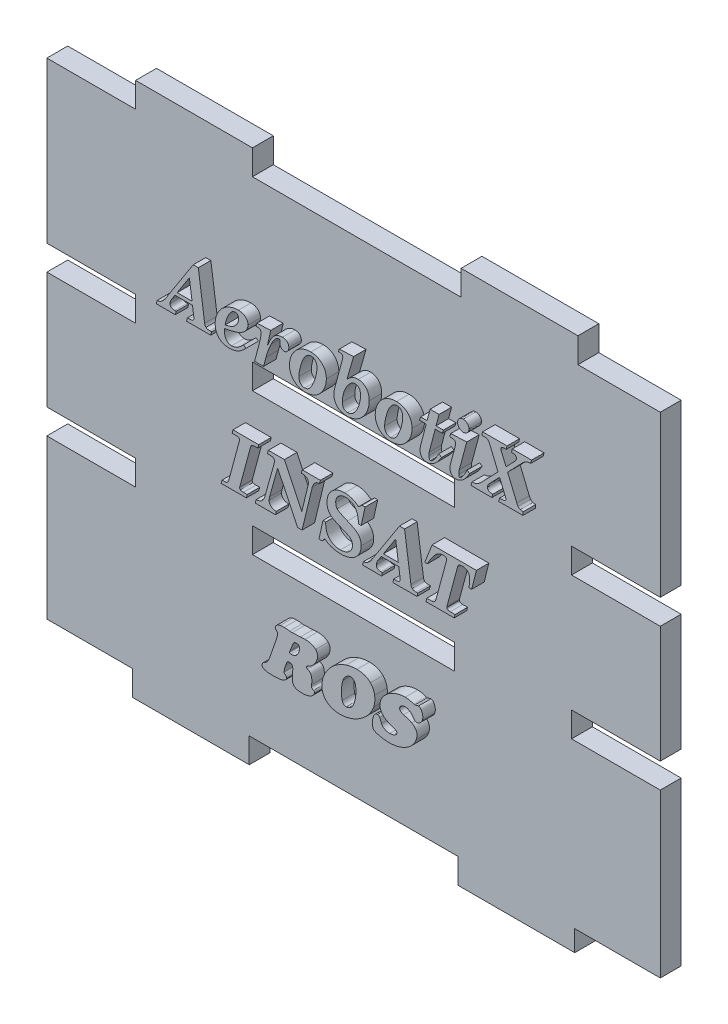
from build123d import *

# Parameters (mm, degrees)
BOSS_EXTRUDE1_DEPTH = 5
SKETCH2_W           = 46.467594828
SKETCH2_H           = 4
SKETCH2_W_2         = 20.266202586
SKETCH2_H_2         = 3.750431867
SKETCH2_W_3         = 21.036443238
SKETCH2_H_3         = 4.986905628
SKETCH2_W_4         = 19.500187061
CUT_EXTRUDE1_DEPTH  = 5
SKETCH4_W           = 21.266015525
SKETCH4_H           = 6
SKETCH4_W_2         = 50
SKETCH4_W_3         = 19.733984475
CUT_EXTRUDE2_DEPTH  = 5
BOSS_EXTRUDE2_DEPTH = 3
BOSS_EXTRUDE3_DEPTH = 3
SKETCH7_W           = 21.266202586
SKETCH7_H           = 6
SKETCH7_W_2         = 48.467594828
CUT_EXTRUDE3_DEPTH  = 5
SKETCH8_W           = 147
SKETCH8_H           = 16.683674381
CUT_EXTRUDE4_DEPTH  = 104.395814483
SKETCH9_W           = 48.467594828
SKETCH9_H           = 6
SKETCH9_W_2         = 21.266202586
SKETCH9_W_3         = 20.500187061
SKETCH9_H_2         = 5
SKETCH9_W_4         = 50
SKETCH9_W_5         = 20.536443238
SKETCH9_H_3         = 5.986905628
CUT_EXTRUDE5_DEPTH  = 104.395814483
BOSS_EXTRUDE4_DEPTH = 3


with BuildPart() as part:
    # Sketch1 → Boss-Extrude1 (new body)
    with BuildSketch(Plane.XY):
        Polygon((-24, -72.549599747), (-73.5, -72.549599747), (-73.5, 72.549599747), (73.5, 72.549599747), (73.5, -72.549599747), (24, -72.549599747), (24, -67.549599747), (-24, -67.549599747), align=None)
    extrude(amount=BOSS_EXTRUDE1_DEPTH)

    # Sketch2 → Cut-Extrude1 (cut)
    with BuildSketch(Plane.XY.offset(5)):
        with Locations((0, -25.549599747)):
            Rectangle(SKETCH2_W, SKETCH2_H)
        with Locations((63.366898707, -25.424815681)):
            Rectangle(SKETCH2_W_2, SKETCH2_H_2)
        with Locations((-63.366898707, -25.549599747)):
            Rectangle(SKETCH2_W_2, SKETCH2_H)
        with Locations((-64.481778381, -70.056146933)):
            Rectangle(SKETCH2_W_3, SKETCH2_H_3)
        with Locations((63.74990647, -70.549599747)):
            Rectangle(SKETCH2_W_4, SKETCH2_H)
    extrude(amount=-CUT_EXTRUDE1_DEPTH, mode=Mode.SUBTRACT)

    # Sketch4 → Cut-Extrude2 (cut)
    with BuildSketch(Plane.XY.offset(5)):
        with Locations((-62.866992237, 52.865925366)):
            Rectangle(SKETCH4_W, SKETCH4_H)
        with Locations((0.766015525, 52.865925366)):
            Rectangle(SKETCH4_W_2, SKETCH4_H)
        with Locations((63.633007763, 52.865925366)):
            Rectangle(SKETCH4_W_3, SKETCH4_H)
    extrude(amount=-CUT_EXTRUDE2_DEPTH, mode=Mode.SUBTRACT)

    # Sketch5 → Boss-Extrude2 (add)
    # profile 1 of 10: a face of its own
    with BuildSketch(Plane.XY.offset(5)):
        with BuildLine():
            Line((-35.419100404, 27.506307747), (-34.202898883, 27.506307747))
            Line((-34.202898883, 27.506307747), (-32.685781521, 16.728505398))
            add(Edge.make_bspline(
                [(-32.685781521, 16.728505398), (-32.673405071, 16.652554514), (-32.650233388, 16.510356238), (-32.578125911, 16.320938758), (-32.490671562, 16.161576338), (-32.405573267, 16.087116675), (-32.364804625, 16.051444758)],
                knots=[0, 0, 0, 0, 1.19913992, 2.245077621, 3.159256928, 4, 4, 4, 4], degree=3))
            add(Edge.make_bspline(
                [(-32.364804625, 16.051444758), (-32.301673643, 16.011449416), (-32.171351501, 15.928886491), (-31.944527036, 15.847941608), (-31.689727732, 15.800696005), (-31.510762979, 15.794106402), (-31.416919728, 15.790651029)],
                knots=[0, 0, 0, 0, 0.896077561, 1.849785075, 2.872497767, 4, 4, 4, 4], degree=3))
            Line((-31.416919728, 15.790651029), (-31.025729135, 15.790651029))
            Line((-31.025729135, 15.790651029), (-31.238877856, 14.988208788))
            Line((-31.238877856, 14.988208788), (-37.018969622, 14.988208788))
            Line((-37.018969622, 14.988208788), (-36.823374326, 15.790651029))
            Line((-36.823374326, 15.790651029), (-36.40209215, 15.790651029))
            add(Edge.make_bspline(
                [(-36.40209215, 15.790651029), (-36.299229308, 15.792308471), (-36.111352725, 15.79533575), (-35.85502699, 15.82256042), (-35.652166639, 15.873744224), (-35.494151088, 15.942575461), (-35.382218879, 16.041722429), (-35.304593731, 16.161255127), (-35.258638502, 16.303196111), (-35.253679416, 16.404674421), (-35.25108906, 16.457681142)],
                knots=[0, 0, 0, 0, 1.627737526, 2.973024647, 4.067005024, 4.930797178, 5.671134996, 6.397517551, 7.162950778, 8, 8, 8, 8], degree=3))
            add(Edge.make_bspline(
                [(-35.25108906, 16.457681142), (-35.251760256, 16.500400492), (-35.253188381, 16.591295926), (-35.268205865, 16.68097435), (-35.27616538, 16.728505398)],
                knots=[0, 0, 0, 0, 0.939966914, 2, 2, 2, 2], degree=3))
            Line((-35.27616538, 16.728505398), (-35.594634645, 19.000419993))
            Line((-35.594634645, 19.000419993), (-39.792410617, 19.000419993))
            Line((-39.792410617, 19.000419993), (-40.639990234, 17.686420824))
            add(Edge.make_bspline(
                [(-40.639990234, 17.686420824), (-40.693381063, 17.597372391), (-40.794816214, 17.42819275), (-40.902688809, 17.167230218), (-40.973870365, 16.918663683), (-40.983774863, 16.75484364), (-40.988551083, 16.675845126)],
                knots=[0, 0, 0, 0, 1.14988981, 2.184630764, 3.124579206, 4, 4, 4, 4], degree=3))
            add(Edge.make_bspline(
                [(-40.988551083, 16.675845126), (-40.985701949, 16.609350324), (-40.980261784, 16.482384467), (-40.92433624, 16.304226375), (-40.839397118, 16.14702955), (-40.714261072, 16.016284616), (-40.554782262, 15.910996091), (-40.357282045, 15.840151427), (-40.125180146, 15.798348865), (-39.958948628, 15.793331384), (-39.870147209, 15.790651029)],
                knots=[0, 0, 0, 0, 0.981158877, 1.87343483, 2.737388378, 3.603818457, 4.523378636, 5.541286218, 6.686547096, 8, 8, 8, 8], degree=3))
            Line((-39.870147209, 15.790651029), (-39.524093993, 15.790651029))
            Line((-39.524093993, 15.790651029), (-39.717181657, 14.988208788))
            Line((-39.717181657, 14.988208788), (-44.255995583, 14.988208788))
            Line((-44.255995583, 14.988208788), (-44.060400286, 15.790651029))
            add(Edge.make_bspline(
                [(-44.060400286, 15.790651029), (-43.968103762, 15.798341517), (-43.791031058, 15.813095868), (-43.543428183, 15.871124753), (-43.323192144, 15.952019113), (-43.198263274, 16.032446395), (-43.137591709, 16.071505814)],
                knots=[0, 0, 0, 0, 1.136170696, 2.179765923, 3.116005366, 4, 4, 4, 4], degree=3))
            add(Edge.make_bspline(
                [(-43.137591709, 16.071505814), (-43.033983293, 16.148100807), (-42.834210464, 16.295787636), (-42.570370308, 16.542430626), (-42.340349376, 16.791240346), (-42.216975106, 16.971864661), (-42.157107596, 17.059512823)],
                knots=[0, 0, 0, 0, 1.103396204, 2.127516181, 3.091375012, 4, 4, 4, 4], degree=3))
            Line((-42.157107596, 17.059512823), (-35.419100404, 27.506307747))
        make_face()
        Polygon((-36.346924245, 24.341676159), (-39.273330793, 19.802862234), (-35.707478085, 19.802862234), align=None, mode=Mode.SUBTRACT)
    # profile 2 of 10: a face of its own
    with BuildSketch(Plane.XY.offset(5)):
        with BuildLine():
            add(Edge.make_bspline(
                [(-27.886173868, 18.037489304), (-27.895707229, 17.926383304), (-27.9130369, 17.724415683), (-27.918722752, 17.521796918), (-27.921280716, 17.430642359)],
                knots=[0, 0, 0, 0, 1.10023577, 2, 2, 2, 2], degree=3))
            add(Edge.make_bspline(
                [(-27.921280716, 17.430642359), (-27.920011703, 17.347821511), (-27.917545567, 17.186871659), (-27.893492478, 16.953376865), (-27.86044463, 16.733099148), (-27.807087625, 16.528871239), (-27.742017056, 16.337992493), (-27.662187055, 16.163303464), (-27.568570931, 16.001813744), (-27.458608052, 15.858177947), (-27.337062158, 15.728448704), (-27.205382702, 15.61589213), (-27.062261371, 15.522263535), (-26.911529627, 15.443662555), (-26.749807538, 15.383097773), (-26.577928004, 15.341714605), (-26.396837959, 15.311822835), (-26.272224041, 15.310077332), (-26.208568058, 15.309185685)],
                knots=[0, 0, 0, 0, 1.289432652, 2.505818284, 3.653007062, 4.754983369, 5.788384422, 6.790393566, 7.741553273, 8.68932139, 9.601087962, 10.506231557, 11.380030586, 12.259243778, 13.149091262, 14.061601072, 15.009816144, 16, 16, 16, 16], degree=3))
            add(Edge.make_bspline(
                [(-26.208568058, 15.309185685), (-26.099648625, 15.31314729), (-25.880178298, 15.32112984), (-25.554048536, 15.383201333), (-25.231601465, 15.485753535), (-24.966002399, 15.602374875), (-24.750544116, 15.721160248), (-24.579968867, 15.833348162), (-24.398566498, 15.962847393), (-24.213092665, 16.117888552), (-24.012272282, 16.285343146), (-23.805720752, 16.476218079), (-23.589717678, 16.686691457), (-23.446362564, 16.836708432), (-23.372436263, 16.914070167)],
                knots=[0, 0, 0, 0, 1.166796897, 2.351070779, 3.543886222, 4.787299899, 5.452940811, 6.178517052, 6.974153343, 7.840205449, 8.768169163, 9.776339071, 10.853288003, 12, 12, 12, 12], degree=3))
            Line((-23.372436263, 16.914070167), (-22.785650374, 16.48024983))
            add(Edge.make_bspline(
                [(-22.785650374, 16.48024983), (-22.94874573, 16.312290363), (-23.261758152, 15.989942746), (-23.751111296, 15.564582854), (-24.239931442, 15.221109309), (-24.726848424, 14.94799455), (-25.22491629, 14.751235271), (-25.735021741, 14.610065607), (-26.26399868, 14.521537761), (-26.623655684, 14.511709502), (-26.805384475, 14.506743444)],
                knots=[0, 0, 0, 0, 1.215276831, 2.332357904, 3.360611622, 4.312459549, 5.223963669, 6.133719937, 7.056999267, 8, 8, 8, 8], degree=3))
            add(Edge.make_bspline(
                [(-26.805384475, 14.506743444), (-26.932554463, 14.509729237), (-27.180943523, 14.515561102), (-27.542811092, 14.558125007), (-27.883989731, 14.630365497), (-28.203598641, 14.734124254), (-28.504125462, 14.86339076), (-28.781386452, 15.026068638), (-29.039572202, 15.21487832), (-29.274705466, 15.433190425), (-29.485998368, 15.676882306), (-29.668851244, 15.942920011), (-29.823768156, 16.229525562), (-29.948437916, 16.537845935), (-30.049139312, 16.865593134), (-30.11938294, 17.214966584), (-30.15858673, 17.584376334), (-30.164891298, 17.837623151), (-30.16811899, 17.967275608)],
                knots=[0, 0, 0, 0, 1.117224344, 2.182168208, 3.196286246, 4.176432022, 5.130220092, 6.064899333, 6.99474726, 7.935437917, 8.877847255, 9.823114117, 10.766238647, 11.734591352, 12.740565232, 13.774750075, 14.860759149, 16, 16, 16, 16], degree=3))
            add(Edge.make_bspline(
                [(-30.16811899, 17.967275608), (-30.165528835, 18.085218808), (-30.160355692, 18.320778881), (-30.124153883, 18.671778312), (-30.066552315, 19.018537815), (-29.986436111, 19.361526803), (-29.879989634, 19.700278742), (-29.752283464, 20.036235228), (-29.601795367, 20.36849691), (-29.426181368, 20.692739334), (-29.231449107, 21.007811661), (-29.019314472, 21.308137923), (-28.789178196, 21.590745972), (-28.543733829, 21.85707465), (-28.279668372, 22.105777785), (-27.998205605, 22.337073364), (-27.699378442, 22.549791727), (-27.386430909, 22.745371132), (-27.061418477, 22.920433724), (-26.727808446, 23.073031491), (-26.389182043, 23.204637169), (-26.043582475, 23.309644156), (-25.692090915, 23.393623464), (-25.333149013, 23.449867184), (-24.968882018, 23.486488964), (-24.72413775, 23.49155255), (-24.601175944, 23.494096542)],
                knots=[0, 0, 0, 0, 0.976132897, 1.949565016, 2.917498797, 3.8841212, 4.86228702, 5.85425309, 6.857423291, 7.878939345, 8.904197228, 9.921604898, 10.920016122, 11.918786852, 12.917222047, 13.920010452, 14.931780295, 15.951162056, 16.972678109, 17.985015512, 18.985916662, 19.97730351, 20.972449275, 21.974521419, 22.982380637, 24, 24, 24, 24], degree=3))
            add(Edge.make_bspline(
                [(-24.601175944, 23.494096542), (-24.512489003, 23.493181952), (-24.339664164, 23.491399684), (-24.089165275, 23.462350487), (-23.853864092, 23.419442472), (-23.63267558, 23.364237393), (-23.427617536, 23.28448247), (-23.237549804, 23.190131903), (-23.062185389, 23.078953888), (-22.904824997, 22.95103979), (-22.764223138, 22.810216924), (-22.64094009, 22.660219774), (-22.537186324, 22.500196731), (-22.450691535, 22.331821397), (-22.386583071, 22.152687449), (-22.33763933, 21.965795808), (-22.310388335, 21.768808916), (-22.306281101, 21.634347905), (-22.304185029, 21.565727532)],
                knots=[0, 0, 0, 0, 1.259995388, 2.455361496, 3.578696781, 4.659435567, 5.689954299, 6.699574018, 7.671939146, 8.635040316, 9.576046008, 10.496497782, 11.389625257, 12.282357455, 13.180764858, 14.088552095, 15.024518193, 16, 16, 16, 16], degree=3))
            add(Edge.make_bspline(
                [(-22.304185029, 21.565727532), (-22.310927572, 21.448943712), (-22.324570465, 21.212642756), (-22.423807219, 20.8592328), (-22.583476677, 20.507382333), (-22.767131686, 20.221092944), (-22.942307023, 19.994120385), (-23.099767981, 19.828453422), (-23.275843296, 19.667706223), (-23.471205261, 19.512923309), (-23.686321433, 19.363618869), (-23.921826839, 19.222310423), (-24.175916534, 19.08376905), (-24.451596194, 18.949724127), (-24.755657245, 18.820106296), (-25.09481628, 18.699355634), (-25.468949431, 18.57794265), (-25.881113829, 18.464055279), (-26.330149251, 18.351403879), (-26.815782936, 18.241195879), (-27.338580162, 18.136252613), (-27.699655765, 18.071129473), (-27.886173868, 18.037489304)],
                knots=[0, 0, 0, 0, 0.981040538, 1.985042246, 3.063868762, 4.219941206, 4.835652052, 5.471990201, 6.1384988, 6.838682374, 7.565783226, 8.338293673, 9.146449843, 9.998160207, 10.914419236, 11.923645492, 13.023685264, 14.22061834, 15.517623204, 16.915519757, 18.406673293, 20, 20, 20, 20], degree=3))
        make_face()
        with BuildLine():
            add(Edge.make_bspline(
                [(-27.77583806, 18.839931545), (-27.651054151, 18.864760566), (-27.408744176, 18.91297447), (-27.060635672, 19.000819668), (-26.737786832, 19.097788139), (-26.442281074, 19.207906651), (-26.172953115, 19.327754231), (-25.930136583, 19.458465422), (-25.712956799, 19.60055438), (-25.584078284, 19.708028201), (-25.521476889, 19.76023249)],
                knots=[0, 0, 0, 0, 1.239394995, 2.406702698, 3.496407519, 4.521996393, 5.477033907, 6.366152797, 7.206375752, 8, 8, 8, 8], degree=3))
            add(Edge.make_bspline(
                [(-25.521476889, 19.76023249), (-25.443925798, 19.833194781), (-25.293352254, 19.974858691), (-25.097109015, 20.206430087), (-24.926520452, 20.44095802), (-24.792095301, 20.686593636), (-24.681024773, 20.935390885), (-24.60666018, 21.193696999), (-24.55942672, 21.458664715), (-24.553838627, 21.638248158), (-24.551023304, 21.728723612)],
                knots=[0, 0, 0, 0, 1.128248, 2.190611334, 3.213795633, 4.197837831, 5.154554236, 6.096956526, 7.041232754, 8, 8, 8, 8], degree=3))
            add(Edge.make_bspline(
                [(-24.551023304, 21.728723612), (-24.554173548, 21.799925331), (-24.56019508, 21.936023797), (-24.598158133, 22.128868128), (-24.670228016, 22.296488827), (-24.768324237, 22.43737766), (-24.885970925, 22.551014555), (-25.020350368, 22.634987344), (-25.171289661, 22.683922865), (-25.277053175, 22.689046092), (-25.330896857, 22.691654301)],
                knots=[0, 0, 0, 0, 1.229858297, 2.350811606, 3.372297497, 4.357237952, 5.296382159, 6.177623391, 7.072237075, 8, 8, 8, 8], degree=3))
            add(Edge.make_bspline(
                [(-25.330896857, 22.691654301), (-25.386239024, 22.689028255), (-25.49717543, 22.683764201), (-25.662079563, 22.647416686), (-25.824134732, 22.586519928), (-25.982202552, 22.499439068), (-26.139074107, 22.391766362), (-26.289669068, 22.255517066), (-26.440270206, 22.098997529), (-26.532289346, 21.98040335), (-26.579697594, 21.919303644)],
                knots=[0, 0, 0, 0, 0.871505153, 1.746979833, 2.646963753, 3.5895699, 4.583037995, 5.637129877, 6.782649637, 8, 8, 8, 8], degree=3))
            add(Edge.make_bspline(
                [(-26.579697594, 21.919303644), (-26.649889815, 21.822603614), (-26.792543171, 21.626077795), (-26.979682378, 21.304298885), (-27.152398351, 20.958114949), (-27.310514664, 20.585414781), (-27.453362564, 20.18704093), (-27.577737985, 19.761274695), (-27.689195531, 19.310609359), (-27.746540009, 18.999090596), (-27.77583806, 18.839931545)],
                knots=[0, 0, 0, 0, 0.859700307, 1.747189812, 2.675574047, 3.643444113, 4.659797057, 5.720274367, 6.835258056, 8, 8, 8, 8], degree=3))
        make_face(mode=Mode.SUBTRACT)
    # profile 3 of 10: a face of its own
    with BuildSketch(Plane.XY.offset(5)):
        with BuildLine():
            Line((-20.157652035, 23.012631198), (-16.852593055, 23.173119646))
            Line((-16.852593055, 23.173119646), (-17.667573456, 19.542068506))
            add(Edge.make_bspline(
                [(-17.667573456, 19.542068506), (-17.601748063, 19.704671738), (-17.475121755, 20.017466638), (-17.27578736, 20.461455418), (-17.083565374, 20.865799718), (-16.895459676, 21.229610502), (-16.714408068, 21.554403207), (-16.53286746, 21.835477053), (-16.359416718, 22.078724825), (-16.235958582, 22.219415155), (-16.178040046, 22.285417917)],
                knots=[0, 0, 0, 0, 1.342415811, 2.582364531, 3.724027319, 4.768342843, 5.716538923, 6.568290603, 7.328334982, 8, 8, 8, 8], degree=3))
            add(Edge.make_bspline(
                [(-16.178040046, 22.285417917), (-16.099920096, 22.356349473), (-15.945994655, 22.496111095), (-15.696290013, 22.675949243), (-15.439348012, 22.830669457), (-15.173394976, 22.957035803), (-14.89771744, 23.051389068), (-14.616366392, 23.123516428), (-14.325196363, 23.163347671), (-14.128579587, 23.169834349), (-14.02899942, 23.173119646)],
                knots=[0, 0, 0, 0, 1.061480286, 2.091512078, 3.091550035, 4.07772142, 5.049026958, 6.020441829, 6.997416514, 8, 8, 8, 8], degree=3))
            add(Edge.make_bspline(
                [(-14.02899942, 23.173119646), (-13.918976127, 23.169835561), (-13.708765394, 23.163560981), (-13.412008699, 23.087086291), (-13.147080505, 22.970396362), (-12.923211813, 22.79987832), (-12.741869257, 22.594051891), (-12.60631605, 22.357004233), (-12.527341013, 22.088901119), (-12.518782312, 21.90059686), (-12.51438969, 21.803952572)],
                knots=[0, 0, 0, 0, 1.147788183, 2.19296649, 3.182608362, 4.156372597, 5.110238538, 6.033991048, 6.990975904, 8, 8, 8, 8], degree=3))
            add(Edge.make_bspline(
                [(-12.51438969, 21.803952572), (-12.518913291, 21.710828768), (-12.52770275, 21.529887091), (-12.590530151, 21.26970768), (-12.700112364, 21.034573842), (-12.851162756, 20.831340244), (-13.0256154, 20.660056279), (-13.222683547, 20.537279758), (-13.434047568, 20.459105645), (-13.58114675, 20.449607897), (-13.655362251, 20.444816027)],
                knots=[0, 0, 0, 0, 1.136176863, 2.207617579, 3.2436959, 4.280326622, 5.283326792, 6.209045702, 7.096415297, 8, 8, 8, 8], degree=3))
            add(Edge.make_bspline(
                [(-13.655362251, 20.444816027), (-13.719347532, 20.4477576), (-13.844848325, 20.453527203), (-14.02402116, 20.512178969), (-14.188648501, 20.603891747), (-14.331588912, 20.732280131), (-14.452079442, 20.883353948), (-14.539644752, 21.055445173), (-14.590381759, 21.243559376), (-14.597247977, 21.374010341), (-14.600739517, 21.440345932)],
                knots=[0, 0, 0, 0, 1.002452448, 1.966211214, 2.930685731, 3.945113291, 4.964629985, 5.951472357, 6.95830366, 8, 8, 8, 8], degree=3))
            add(Edge.make_bspline(
                [(-14.600739517, 21.440345932), (-14.600739517, 21.523097788), (-14.600739517, 21.698632028), (-14.600739517, 21.874166268), (-14.600739517, 21.966948652)],
                knots=[0, 0, 0, 0, 0.942857143, 2, 2, 2, 2], degree=3))
            add(Edge.make_bspline(
                [(-14.600739517, 21.966948652), (-14.600739517, 21.996204359), (-14.600739517, 22.047192877), (-14.600739517, 22.098181394), (-14.600739517, 22.119914205)],
                knots=[0, 0, 0, 0, 1.147540984, 2, 2, 2, 2], degree=3))
            add(Edge.make_bspline(
                [(-14.600739517, 22.119914205), (-14.604633562, 22.1519835), (-14.612642305, 22.217939263), (-14.679001853, 22.296541055), (-14.764195871, 22.360151549), (-14.835291933, 22.36712148), (-14.871563773, 22.370677405)],
                knots=[0, 0, 0, 0, 0.936663483, 1.926402031, 2.942090323, 4, 4, 4, 4], degree=3))
            add(Edge.make_bspline(
                [(-14.871563773, 22.370677405), (-14.931504905, 22.365943879), (-15.060068055, 22.355791301), (-15.255534076, 22.276791212), (-15.465704327, 22.16077068), (-15.648596751, 22.029421117), (-15.801951387, 21.893548907), (-15.923453786, 21.759998994), (-16.049300519, 21.600376033), (-16.179241147, 21.41411276), (-16.314026074, 21.201647533), (-16.451725941, 20.961779394), (-16.595216199, 20.696522246), (-16.686980897, 20.507877872), (-16.734734351, 20.409709179)],
                knots=[0, 0, 0, 0, 0.762448154, 1.635316719, 2.655604188, 3.82345821, 4.494964078, 5.263934069, 6.120792562, 7.084326867, 8.157156896, 9.326613346, 10.608795653, 12, 12, 12, 12], degree=3))
            add(Edge.make_bspline(
                [(-16.734734351, 20.409709179), (-16.864701101, 20.130955128), (-17.122794946, 19.577392739), (-17.456200153, 18.729774204), (-17.753182675, 17.879796207), (-17.9153567, 17.305317667), (-17.996073248, 17.019390711)],
                knots=[0, 0, 0, 0, 1.018667967, 2.022916876, 3.015974802, 4, 4, 4, 4], degree=3))
            Line((-17.996073248, 17.019390711), (-18.572828609, 14.82772034))
            Line((-18.572828609, 14.82772034), (-20.724376868, 14.82772034))
            Line((-20.724376868, 14.82772034), (-19.520713506, 19.374057161))
            add(Edge.make_bspline(
                [(-19.520713506, 19.374057161), (-19.493580854, 19.477608497), (-19.440959388, 19.678437482), (-19.370790667, 19.971903082), (-19.310189581, 20.248554132), (-19.259276323, 20.509158917), (-19.221231441, 20.753420612), (-19.197491051, 20.981202068), (-19.177093123, 21.191730281), (-19.175450093, 21.327457088), (-19.17466029, 21.392700924)],
                knots=[0, 0, 0, 0, 1.251111759, 2.42642455, 3.526355183, 4.561004516, 5.52956969, 6.414239298, 7.237725304, 8, 8, 8, 8], degree=3))
            add(Edge.make_bspline(
                [(-19.17466029, 21.392700924), (-19.177226465, 21.472330289), (-19.18194478, 21.618741303), (-19.223060797, 21.819292633), (-19.293681875, 21.980030451), (-19.404292514, 22.104381656), (-19.566674069, 22.185672599), (-19.782909449, 22.235943489), (-20.059794549, 22.267239073), (-20.265381395, 22.267642735), (-20.378323651, 22.267864493)],
                knots=[0, 0, 0, 0, 1.083723772, 1.99259529, 2.77186058, 3.448857453, 4.213006247, 5.201596234, 6.462654398, 8, 8, 8, 8], degree=3))
            Line((-20.378323651, 22.267864493), (-20.157652035, 23.012631198))
        make_face()
    # profile 4 of 10: a face of its own
    with BuildSketch(Plane.XY.offset(5)):
        with BuildLine():
            add(Edge.make_bspline(
                [(-7.245854852, 23.494096542), (-7.11199244, 23.490367502), (-6.849264124, 23.483048609), (-6.464317363, 23.436141573), (-6.098403389, 23.352505178), (-5.751119828, 23.237553825), (-5.423106893, 23.089043699), (-5.115145808, 22.906676354), (-4.82543874, 22.693115459), (-4.558734629, 22.447239978), (-4.315274667, 22.178050659), (-4.104984216, 21.886218878), (-3.925052753, 21.578456884), (-3.778562194, 21.252410652), (-3.666092098, 20.908386288), (-3.586592367, 20.546301423), (-3.534000159, 20.168013946), (-3.529381642, 19.909199036), (-3.527036592, 19.777785914)],
                knots=[0, 0, 0, 0, 1.089394915, 2.138127388, 3.149669057, 4.13915119, 5.110248765, 6.073860701, 7.046600715, 8.033577915, 9.02102381, 9.995237277, 10.955409836, 11.917508038, 12.898395413, 13.895168921, 14.931273223, 16, 16, 16, 16], degree=3))
            add(Edge.make_bspline(
                [(-3.527036592, 19.777785914), (-3.531497429, 19.609571272), (-3.540319873, 19.276883898), (-3.607008743, 18.784697797), (-3.71812575, 18.306584271), (-3.871103173, 17.840118991), (-4.070479616, 17.388179821), (-4.312486234, 16.948912986), (-4.600622264, 16.525016245), (-4.924965705, 16.116797342), (-5.285144235, 15.739631346), (-5.677748285, 15.407243787), (-6.102645578, 15.132006255), (-6.550649171, 14.90005783), (-7.029158546, 14.725704474), (-7.533546051, 14.596264371), (-8.066909725, 14.520760749), (-8.43172854, 14.51147344), (-8.617529558, 14.506743444)],
                knots=[0, 0, 0, 0, 0.989049682, 1.956098104, 2.91480212, 3.872371231, 4.838669732, 5.815550796, 6.817646548, 7.849444325, 8.878533582, 9.87990566, 10.86702334, 11.849737097, 12.840483336, 13.855088396, 14.907603603, 16, 16, 16, 16], degree=3))
            add(Edge.make_bspline(
                [(-8.617529558, 14.506743444), (-8.753889665, 14.510481443), (-9.020767621, 14.51779729), (-9.410857765, 14.564208577), (-9.779463908, 14.649133502), (-10.130267128, 14.760067274), (-10.460244886, 14.909432221), (-10.769631385, 15.0911451), (-11.06109063, 15.302682644), (-11.327414493, 15.547749928), (-11.566888496, 15.818590877), (-11.780547378, 16.106916524), (-11.955227903, 16.418350221), (-12.102027647, 16.745174981), (-12.215668732, 17.091441913), (-12.293940169, 17.456320668), (-12.347124862, 17.838664216), (-12.35161465, 18.099993144), (-12.353901242, 18.2330846)],
                knots=[0, 0, 0, 0, 1.103904577, 2.160513098, 3.173295853, 4.161853674, 5.133973299, 6.098314802, 7.06189642, 8.043646214, 9.021353994, 9.984935612, 10.942512063, 11.905689748, 12.881381971, 13.886086298, 14.923410984, 16, 16, 16, 16], degree=3))
            add(Edge.make_bspline(
                [(-12.353901242, 18.2330846), (-12.352121009, 18.348505741), (-12.348566249, 18.578978033), (-12.31535017, 18.921727703), (-12.259014662, 19.259725628), (-12.184790003, 19.593527416), (-12.08601612, 19.923387296), (-11.965945375, 20.24822114), (-11.824427302, 20.56896736), (-11.662827122, 20.88217862), (-11.482408391, 21.185074289), (-11.287831193, 21.472665818), (-11.078924244, 21.742855231), (-10.855045969, 21.993155103), (-10.619908991, 22.228159098), (-10.366604128, 22.441260528), (-10.10230989, 22.639834736), (-9.822345843, 22.817671984), (-9.533169763, 22.978038065), (-9.233368946, 23.116966226), (-8.92361572, 23.232095929), (-8.605173294, 23.326951854), (-8.278008196, 23.403565284), (-7.941708349, 23.454492774), (-7.596819211, 23.489281794), (-7.363802147, 23.492478468), (-7.245854852, 23.494096542)],
                knots=[0, 0, 0, 0, 1.017839218, 2.032415693, 3.033563478, 4.038747892, 5.046443617, 6.068120532, 7.0914188, 8.136684174, 9.174748653, 10.199214827, 11.197589871, 12.184548281, 13.159426911, 14.127030226, 15.10168581, 16.073129448, 17.049874089, 18.016381383, 18.984546279, 19.961875056, 20.945495923, 21.945475744, 22.96005222, 24, 24, 24, 24], degree=3))
        make_face()
        with BuildLine():
            add(Edge.make_bspline(
                [(-7.135519044, 22.691654301), (-7.192468368, 22.689579111), (-7.305357779, 22.685465508), (-7.471900745, 22.657013694), (-7.633895218, 22.611145939), (-7.792776805, 22.549017271), (-7.945841761, 22.464980034), (-8.094291824, 22.364075222), (-8.239048856, 22.245183282), (-8.328308199, 22.154229811), (-8.374289253, 22.107376045)],
                knots=[0, 0, 0, 0, 0.969134893, 1.921095084, 2.866975808, 3.831294834, 4.818023575, 5.83216807, 6.883263157, 8, 8, 8, 8], degree=3))
            add(Edge.make_bspline(
                [(-8.374289253, 22.107376045), (-8.437228996, 22.036390891), (-8.566408082, 21.890699203), (-8.744480945, 21.648473763), (-8.911969105, 21.37846648), (-9.072833775, 21.082483023), (-9.222453015, 20.75758559), (-9.364536936, 20.406645647), (-9.500840293, 20.029881895), (-9.622548608, 19.633282586), (-9.731978952, 19.23353601), (-9.834230096, 18.848178897), (-9.916767039, 18.481600662), (-9.983479313, 18.135946567), (-10.041428696, 17.811298426), (-10.07775035, 17.506477077), (-10.10231115, 17.222075115), (-10.105519748, 17.039497763), (-10.107062967, 16.951684647)],
                knots=[0, 0, 0, 0, 0.823439471, 1.690047563, 2.606322013, 3.580607108, 4.61318934, 5.71027936, 6.867356374, 8.090925028, 9.311217377, 10.466015871, 11.552394314, 12.572969367, 13.522751413, 14.414878089, 15.237613574, 16, 16, 16, 16], degree=3))
            add(Edge.make_bspline(
                [(-10.107062967, 16.951684647), (-10.102288743, 16.826818458), (-10.09323187, 16.589942883), (-10.024934049, 16.256128788), (-9.903500568, 15.96820844), (-9.733851338, 15.728360561), (-9.522678571, 15.54046596), (-9.2792792, 15.403745961), (-9.003459684, 15.324784737), (-8.810288596, 15.314505668), (-8.710311942, 15.309185685)],
                knots=[0, 0, 0, 0, 1.229766555, 2.332910639, 3.336357753, 4.286949671, 5.202658854, 6.098490275, 7.015864216, 8, 8, 8, 8], degree=3))
            add(Edge.make_bspline(
                [(-8.710311942, 15.309185685), (-8.612719089, 15.313422302), (-8.419101008, 15.321827485), (-8.14066158, 15.407198666), (-7.877654698, 15.537791905), (-7.726749034, 15.663618799), (-7.649583605, 15.727960229)],
                knots=[0, 0, 0, 0, 1.00092916, 1.985780483, 2.970031287, 4, 4, 4, 4], degree=3))
            add(Edge.make_bspline(
                [(-7.649583605, 15.727960229), (-7.592354572, 15.78452609), (-7.473327349, 15.902174021), (-7.311280923, 16.10966572), (-7.147841868, 16.345152006), (-6.988742811, 16.614167257), (-6.83078282, 16.912999395), (-6.675823199, 17.243295055), (-6.520144367, 17.603041406), (-6.372797028, 17.989245288), (-6.234544376, 18.38636726), (-6.11007748, 18.783021777), (-6.008445332, 19.174252382), (-5.92169593, 19.557770877), (-5.857290151, 19.934607624), (-5.808516581, 20.303362497), (-5.78048642, 20.665886702), (-5.776066564, 20.905340014), (-5.773874866, 21.024079019)],
                knots=[0, 0, 0, 0, 0.673936533, 1.401680043, 2.202502693, 3.076164793, 4.019675939, 5.035245033, 6.133843712, 7.305041502, 8.499506752, 9.658673353, 10.788929146, 11.887192562, 12.953954163, 13.99258966, 15.00457461, 16, 16, 16, 16], degree=3))
            add(Edge.make_bspline(
                [(-5.773874866, 21.024079019), (-5.778771882, 21.148069304), (-5.78809124, 21.384031365), (-5.855498925, 21.71856783), (-5.98163653, 22.007757235), (-6.149019682, 22.253671139), (-6.356241612, 22.448635168), (-6.591985266, 22.590343595), (-6.855449024, 22.677328643), (-7.040394871, 22.686788674), (-7.135519044, 22.691654301)],
                knots=[0, 0, 0, 0, 1.231316899, 2.343280966, 3.365659712, 4.344237098, 5.277955194, 6.167689091, 7.057577859, 8, 8, 8, 8], degree=3))
        make_face(mode=Mode.SUBTRACT)
    # profile 5 of 10: a face of its own
    with BuildSketch(Plane.XY.offset(5)):
        with BuildLine():
            Line((-0.42008054, 27.506307747), (3.000329512, 27.666796195))
            Line((3.000329512, 27.666796195), (1.410490822, 22.134959997))
            add(Edge.make_bspline(
                [(1.410490822, 22.134959997), (1.531531881, 22.257289474), (1.760651438, 22.488847888), (2.113360899, 22.787172862), (2.442565238, 23.030826665), (2.764777168, 23.20887427), (3.084509984, 23.337532925), (3.413386698, 23.427843189), (3.757313524, 23.484939426), (3.992292061, 23.491019517), (4.111210489, 23.494096542)],
                knots=[0, 0, 0, 0, 1.322855923, 2.504044202, 3.549525109, 4.467387315, 5.326888838, 6.194049248, 7.08604068, 8, 8, 8, 8], degree=3))
            add(Edge.make_bspline(
                [(4.111210489, 23.494096542), (4.205820151, 23.492005642), (4.391750768, 23.487896522), (4.663070615, 23.446184668), (4.922194575, 23.381135109), (5.167348693, 23.289076168), (5.398274978, 23.168399252), (5.617798092, 23.026329081), (5.82203534, 22.853338103), (6.010875, 22.655874136), (6.184735199, 22.437952088), (6.336412109, 22.198840284), (6.460202965, 21.938269716), (6.567232077, 21.662403812), (6.646788823, 21.365491118), (6.704422439, 21.050235633), (6.736036014, 20.715443967), (6.741452155, 20.486671144), (6.744224092, 20.369587067)],
                knots=[0, 0, 0, 0, 0.987402558, 1.94048222, 2.859366782, 3.773803727, 4.667888748, 5.575844247, 6.499072462, 7.45602215, 8.425354291, 9.406213713, 10.405697736, 11.433561012, 12.492428691, 13.610524944, 14.777086027, 16, 16, 16, 16], degree=3))
            add(Edge.make_bspline(
                [(6.744224092, 20.369587067), (6.741689595, 20.241612105), (6.736644344, 19.986861044), (6.699794538, 19.606772369), (6.643827385, 19.2311379), (6.559254872, 18.860585509), (6.454231148, 18.494580488), (6.326518558, 18.132284631), (6.172650463, 17.77610233), (5.997672139, 17.427499906), (5.806917961, 17.089253524), (5.594232391, 16.771601501), (5.37314233, 16.469300703), (5.132449898, 16.190270522), (4.879883397, 15.928560811), (4.610865611, 15.688316503), (4.329019928, 15.465392611), (4.031555179, 15.266187817), (3.723462496, 15.089061216), (3.409569422, 14.931681485), (3.087055034, 14.801826391), (2.759032342, 14.693142871), (2.423452579, 14.610770214), (2.081850403, 14.549843512), (1.733044526, 14.514617261), (1.498333672, 14.509376668), (1.380399238, 14.506743444)],
                knots=[0, 0, 0, 0, 1.045475324, 2.0811567, 3.117558393, 4.146484934, 5.1840336, 6.22734292, 7.282830669, 8.351820604, 9.413235321, 10.453141417, 11.473487256, 12.471299495, 13.461392372, 14.44315903, 15.415929083, 16.395222174, 17.365159166, 18.318092231, 19.261654981, 20.203287899, 21.139157286, 22.082324494, 23.036431545, 24, 24, 24, 24], degree=3))
            add(Edge.make_bspline(
                [(1.380399238, 14.506743444), (1.226230638, 14.510187221), (0.926913535, 14.516873287), (0.495150525, 14.594128004), (0.092057122, 14.705726977), (-0.275083293, 14.873098398), (-0.606617067, 15.081560055), (-0.898330698, 15.333233233), (-1.15152189, 15.624082571), (-1.361765122, 15.953204492), (-1.525979795, 16.312685313), (-1.648287857, 16.693541447), (-1.718772414, 17.095369105), (-1.728927143, 17.369356306), (-1.73407971, 17.508378951)],
                knots=[0, 0, 0, 0, 1.138369329, 2.210134934, 3.232952002, 4.223045741, 5.181351288, 6.119033575, 7.06075906, 8.022386025, 8.995617347, 9.974716274, 10.972359658, 12, 12, 12, 12], degree=3))
            add(Edge.make_bspline(
                [(-1.73407971, 17.508378951), (-1.732676586, 17.599539059), (-1.729917388, 17.778802581), (-1.707144696, 18.040110304), (-1.670320002, 18.289145764), (-1.632399616, 18.448132671), (-1.613713374, 18.526477544)],
                knots=[0, 0, 0, 0, 1.064116368, 2.092551801, 3.060056012, 4, 4, 4, 4], degree=3))
            Line((-1.613713374, 18.526477544), (0.372331173, 25.896408001))
            add(Edge.make_bspline(
                [(0.372331173, 25.896408001), (0.385080491, 25.958885475), (0.410242417, 26.08219038), (0.413402178, 26.20798804), (0.414960917, 26.270045169)],
                knots=[0, 0, 0, 0, 1.013381804, 2, 2, 2, 2], degree=3))
            add(Edge.make_bspline(
                [(0.414960917, 26.270045169), (0.413149286, 26.314497753), (0.409684281, 26.399519753), (0.380396378, 26.519930895), (0.325837545, 26.623190515), (0.250876401, 26.71073645), (0.152679758, 26.785143537), (0.022369307, 26.82920167), (-0.132712446, 26.860264574), (-0.246008032, 26.862919263), (-0.3072371, 26.864353954)],
                knots=[0, 0, 0, 0, 0.994651356, 1.902414648, 2.747855356, 3.584133382, 4.467455787, 5.468424682, 6.631844352, 8, 8, 8, 8], degree=3))
            Line((-0.3072371, 26.864353954), (-0.638244525, 26.864353954))
            Line((-0.638244525, 26.864353954), (-0.42008054, 27.506307747))
        make_face()
        with BuildLine():
            add(Edge.make_bspline(
                [(3.426626952, 22.210188957), (3.330673413, 22.204051207), (3.134897388, 22.191528228), (2.843794283, 22.096601796), (2.551873698, 21.947601727), (2.372157237, 21.808843394), (2.278131495, 21.736246508)],
                knots=[0, 0, 0, 0, 0.908036079, 1.852685125, 2.876547681, 4, 4, 4, 4], degree=3))
            add(Edge.make_bspline(
                [(2.278131495, 21.736246508), (2.211088075, 21.677970972), (2.074395567, 21.559155), (1.8843207, 21.356714936), (1.701147091, 21.132228286), (1.523001185, 20.88647853), (1.351927719, 20.616973805), (1.190309757, 20.323935765), (1.034880044, 20.008886497), (0.835159229, 19.565881078), (0.628167433, 18.993346838), (0.441354003, 18.297775294), (0.330714308, 17.600529147), (0.314956369, 17.135113133), (0.307132741, 16.904039639)],
                knots=[0, 0, 0, 0, 0.596523667, 1.216231451, 1.862692809, 2.542333416, 3.254338515, 4.006014917, 4.789636617, 5.614189887, 7.270034087, 8.873378258, 10.447669635, 12, 12, 12, 12], degree=3))
            add(Edge.make_bspline(
                [(0.307132741, 16.904039639), (0.3110424, 16.777502068), (0.318378569, 16.540064249), (0.382665045, 16.209384868), (0.489463077, 15.928675303), (0.642186575, 15.699412349), (0.833765828, 15.523690076), (1.055395185, 15.396850532), (1.307259476, 15.322891159), (1.484391782, 15.31385742), (1.575994534, 15.309185685)],
                knots=[0, 0, 0, 0, 1.314083108, 2.46577382, 3.483687874, 4.416127949, 5.30144739, 6.161296798, 7.049127306, 8, 8, 8, 8], degree=3))
            add(Edge.make_bspline(
                [(1.575994534, 15.309185685), (1.682038473, 15.314815298), (1.894654594, 15.326102568), (2.205983873, 15.424378401), (2.511617153, 15.571157793), (2.69502557, 15.712621761), (2.789688423, 15.785635765)],
                knots=[0, 0, 0, 0, 0.955018343, 1.914793967, 2.923759566, 4, 4, 4, 4], degree=3))
            add(Edge.make_bspline(
                [(2.789688423, 15.785635765), (2.855223422, 15.841232985), (2.988447086, 15.954254507), (3.170080506, 16.150788245), (3.3485381, 16.363393633), (3.520215738, 16.596972165), (3.678765216, 16.854765537), (3.836337713, 17.129845921), (3.979364247, 17.429927488), (4.168148914, 17.853312296), (4.36621711, 18.409128214), (4.532515804, 19.100215768), (4.640930561, 19.807791928), (4.652198025, 20.28643873), (4.657874265, 20.527567883)],
                knots=[0, 0, 0, 0, 0.589712795, 1.198805228, 1.834581128, 2.495939917, 3.187192206, 3.912047349, 4.671991357, 5.468768906, 7.095621522, 8.714870439, 10.345041678, 12, 12, 12, 12], degree=3))
            add(Edge.make_bspline(
                [(4.657874265, 20.527567883), (4.654996697, 20.664973973), (4.649644024, 20.920568215), (4.586662787, 21.274429935), (4.488017064, 21.572230442), (4.339464187, 21.810172994), (4.154073257, 21.991054577), (3.938225742, 22.119017064), (3.691883213, 22.197813255), (3.517514261, 22.205948551), (3.426626952, 22.210188957)],
                knots=[0, 0, 0, 0, 1.39225795, 2.589791446, 3.633020487, 4.555199895, 5.406683286, 6.235575067, 7.080318881, 8, 8, 8, 8], degree=3))
        make_face(mode=Mode.SUBTRACT)
    # profile 6 of 10: a face of its own
    with BuildSketch(Plane.XY.offset(5)):
        with BuildLine():
            add(Edge.make_bspline(
                [(13.296666515, 23.494096542), (13.430528928, 23.490367502), (13.693257243, 23.483048609), (14.078204004, 23.436141573), (14.444117978, 23.352505178), (14.79140154, 23.237553825), (15.119414475, 23.089043699), (15.427375559, 22.906676354), (15.717082628, 22.693115459), (15.983786739, 22.447239978), (16.227246701, 22.178050659), (16.437537152, 21.886218878), (16.617468615, 21.578456884), (16.763959174, 21.252410652), (16.87642927, 20.908386288), (16.955929001, 20.546301423), (17.008521208, 20.168013946), (17.013139726, 19.909199036), (17.015484776, 19.777785914)],
                knots=[0, 0, 0, 0, 1.089394915, 2.138127388, 3.149669057, 4.13915119, 5.110248765, 6.073860701, 7.046600715, 8.033577915, 9.02102381, 9.995237277, 10.955409836, 11.917508038, 12.898395413, 13.895168921, 14.931273223, 16, 16, 16, 16], degree=3))
            add(Edge.make_bspline(
                [(17.015484776, 19.777785914), (17.011023938, 19.609571272), (17.002201495, 19.276883898), (16.935512625, 18.784697797), (16.824395617, 18.306584271), (16.671418194, 17.840118991), (16.472041752, 17.388179821), (16.230035134, 16.948912986), (15.941899103, 16.525016245), (15.617555663, 16.116797342), (15.257377132, 15.739631346), (14.864773083, 15.407243787), (14.439875789, 15.132006255), (13.991872197, 14.90005783), (13.513362822, 14.725704474), (13.008975316, 14.596264371), (12.475611643, 14.520760749), (12.110792828, 14.51147344), (11.92499181, 14.506743444)],
                knots=[0, 0, 0, 0, 0.989049682, 1.956098104, 2.91480212, 3.872371231, 4.838669732, 5.815550796, 6.817646548, 7.849444325, 8.878533582, 9.87990566, 10.86702334, 11.849737097, 12.840483336, 13.855088396, 14.907603603, 16, 16, 16, 16], degree=3))
            add(Edge.make_bspline(
                [(11.92499181, 14.506743444), (11.788631703, 14.510481443), (11.521753746, 14.51779729), (11.131663602, 14.564208577), (10.76305746, 14.649133502), (10.412254239, 14.760067274), (10.082276482, 14.909432221), (9.772889982, 15.0911451), (9.481430738, 15.302682644), (9.215106874, 15.547749928), (8.975632872, 15.818590877), (8.761973989, 16.106916524), (8.587293464, 16.418350221), (8.44049372, 16.745174981), (8.326852636, 17.091441913), (8.248581199, 17.456320668), (8.195396506, 17.838664216), (8.190906717, 18.099993144), (8.188620126, 18.2330846)],
                knots=[0, 0, 0, 0, 1.103904577, 2.160513098, 3.173295853, 4.161853674, 5.133973299, 6.098314802, 7.06189642, 8.043646214, 9.021353994, 9.984935612, 10.942512063, 11.905689748, 12.881381971, 13.886086298, 14.923410984, 16, 16, 16, 16], degree=3))
            add(Edge.make_bspline(
                [(8.188620126, 18.2330846), (8.190400359, 18.348505741), (8.193955119, 18.578978033), (8.227171198, 18.921727703), (8.283506706, 19.259725628), (8.357731364, 19.593527416), (8.456505247, 19.923387296), (8.576575993, 20.24822114), (8.718094066, 20.56896736), (8.879694245, 20.88217862), (9.060112976, 21.185074289), (9.254690174, 21.472665818), (9.463597123, 21.742855231), (9.687475399, 21.993155103), (9.922612377, 22.228159098), (10.17591724, 22.441260528), (10.440211478, 22.639834736), (10.720175524, 22.817671984), (11.009351604, 22.978038065), (11.309152422, 23.116966226), (11.618905647, 23.232095929), (11.937348074, 23.326951854), (12.264513172, 23.403565284), (12.600813019, 23.454492774), (12.945702157, 23.489281794), (13.17871922, 23.492478468), (13.296666515, 23.494096542)],
                knots=[0, 0, 0, 0, 1.017839218, 2.032415693, 3.033563478, 4.038747892, 5.046443617, 6.068120532, 7.0914188, 8.136684174, 9.174748653, 10.199214827, 11.197589871, 12.184548281, 13.159426911, 14.127030226, 15.10168581, 16.073129448, 17.049874089, 18.016381383, 18.984546279, 19.961875056, 20.945495923, 21.945475744, 22.96005222, 24, 24, 24, 24], degree=3))
        make_face()
        with BuildLine():
            add(Edge.make_bspline(
                [(13.407002324, 22.691654301), (13.350052999, 22.689579111), (13.237163589, 22.685465508), (13.070620622, 22.657013694), (12.908626149, 22.611145939), (12.749744563, 22.549017271), (12.596679607, 22.464980034), (12.448229543, 22.364075222), (12.303472511, 22.245183282), (12.214213168, 22.154229811), (12.168232114, 22.107376045)],
                knots=[0, 0, 0, 0, 0.969134893, 1.921095084, 2.866975808, 3.831294834, 4.818023575, 5.83216807, 6.883263157, 8, 8, 8, 8], degree=3))
            add(Edge.make_bspline(
                [(12.168232114, 22.107376045), (12.105292372, 22.036390891), (11.976113286, 21.890699203), (11.798040423, 21.648473763), (11.630552262, 21.37846648), (11.469687592, 21.082483023), (11.320068353, 20.75758559), (11.177984431, 20.406645647), (11.041681074, 20.029881895), (10.91997276, 19.633282586), (10.810542416, 19.23353601), (10.708291271, 18.848178897), (10.625754329, 18.481600662), (10.559042054, 18.135946567), (10.501092672, 17.811298426), (10.464771018, 17.506477077), (10.440210217, 17.222075115), (10.43700162, 17.039497763), (10.4354584, 16.951684647)],
                knots=[0, 0, 0, 0, 0.823439471, 1.690047563, 2.606322013, 3.580607108, 4.61318934, 5.71027936, 6.867356374, 8.090925028, 9.311217377, 10.466015871, 11.552394314, 12.572969367, 13.522751413, 14.414878089, 15.237613574, 16, 16, 16, 16], degree=3))
            add(Edge.make_bspline(
                [(10.4354584, 16.951684647), (10.440232625, 16.826818458), (10.449289498, 16.589942883), (10.517587319, 16.256128788), (10.6390208, 15.96820844), (10.80867003, 15.728360561), (11.019842797, 15.54046596), (11.263242167, 15.403745961), (11.539061684, 15.324784737), (11.732232772, 15.314505668), (11.832209426, 15.309185685)],
                knots=[0, 0, 0, 0, 1.229766555, 2.332910639, 3.336357753, 4.286949671, 5.202658854, 6.098490275, 7.015864216, 8, 8, 8, 8], degree=3))
            add(Edge.make_bspline(
                [(11.832209426, 15.309185685), (11.929802279, 15.313422302), (12.12342036, 15.321827485), (12.401859787, 15.407198666), (12.664866669, 15.537791905), (12.815772334, 15.663618799), (12.892937763, 15.727960229)],
                knots=[0, 0, 0, 0, 1.00092916, 1.985780483, 2.970031287, 4, 4, 4, 4], degree=3))
            add(Edge.make_bspline(
                [(12.892937763, 15.727960229), (12.950166796, 15.78452609), (13.069194018, 15.902174021), (13.231240444, 16.10966572), (13.394679499, 16.345152006), (13.553778557, 16.614167257), (13.711738548, 16.912999395), (13.866698169, 17.243295055), (14.022377001, 17.603041406), (14.16972434, 17.989245288), (14.307976991, 18.38636726), (14.432443887, 18.783021777), (14.534076036, 19.174252382), (14.620825437, 19.557770877), (14.685231216, 19.934607624), (14.734004786, 20.303362497), (14.762034947, 20.665886702), (14.766454803, 20.905340014), (14.768646501, 21.024079019)],
                knots=[0, 0, 0, 0, 0.673936533, 1.401680043, 2.202502693, 3.076164793, 4.019675939, 5.035245033, 6.133843712, 7.305041502, 8.499506752, 9.658673353, 10.788929146, 11.887192562, 12.953954163, 13.99258966, 15.00457461, 16, 16, 16, 16], degree=3))
            add(Edge.make_bspline(
                [(14.768646501, 21.024079019), (14.763749486, 21.148069304), (14.754430127, 21.384031365), (14.687022443, 21.71856783), (14.560884838, 22.007757235), (14.393501686, 22.253671139), (14.186279756, 22.448635168), (13.950536101, 22.590343595), (13.687072344, 22.677328643), (13.502126497, 22.686788674), (13.407002324, 22.691654301)],
                knots=[0, 0, 0, 0, 1.231316899, 2.343280966, 3.365659712, 4.344237098, 5.277955194, 6.167689091, 7.057577859, 8, 8, 8, 8], degree=3))
        make_face(mode=Mode.SUBTRACT)
    # profile 7 of 10: a face of its own
    with BuildSketch(Plane.XY.offset(5)):
        with BuildLine():
            Line((21.333627085, 25.901423265), (23.482667711, 25.901423265))
            Line((23.482667711, 25.901423265), (22.76799259, 23.173119646))
            Line((22.76799259, 23.173119646), (24.528350256, 23.173119646))
            Line((24.528350256, 23.173119646), (24.265048896, 22.370677405))
            Line((24.265048896, 22.370677405), (22.557351502, 22.370677405))
            Line((22.557351502, 22.370677405), (21.112955468, 16.863917527))
            add(Edge.make_bspline(
                [(21.112955468, 16.863917527), (21.093526982, 16.742131455), (21.055354403, 16.502849381), (21.048577235, 16.260648668), (21.045249404, 16.14171951)],
                knots=[0, 0, 0, 0, 1.017928917, 2, 2, 2, 2], degree=3))
            add(Edge.make_bspline(
                [(21.045249404, 16.14171951), (21.047020958, 16.076503784), (21.050321383, 15.955006127), (21.065694319, 15.784915636), (21.098320216, 15.640999905), (21.141322402, 15.521191044), (21.200010399, 15.428765276), (21.265817011, 15.360929628), (21.342109949, 15.315346885), (21.398237702, 15.311244675), (21.426409469, 15.309185685)],
                knots=[0, 0, 0, 0, 1.560364919, 2.906978017, 4.075660724, 5.081730688, 5.935699526, 6.67071915, 7.332804384, 8, 8, 8, 8], degree=3))
            add(Edge.make_bspline(
                [(21.426409469, 15.309185685), (21.455814471, 15.311570071), (21.518240647, 15.316632072), (21.613688616, 15.345121322), (21.711987003, 15.394942797), (21.816081824, 15.461366586), (21.925040025, 15.546271373), (22.038806023, 15.650462975), (22.155575333, 15.773894766), (22.27943076, 15.914572383), (22.405782686, 16.076272053), (22.542616977, 16.252959445), (22.678848371, 16.452186914), (22.822856599, 16.66802692), (22.969667045, 16.903712944), (23.123398457, 17.157404141), (23.280628998, 17.430395101), (23.385942467, 17.619418381), (23.440037967, 17.716512408)],
                knots=[0, 0, 0, 0, 0.439037052, 0.93206604, 1.472727101, 2.077782408, 2.770785266, 3.529481609, 4.375667434, 5.303036371, 6.3229313, 7.434637332, 8.634306317, 9.920149823, 11.303294959, 12.773798579, 14.34282377, 16, 16, 16, 16], degree=3))
            Line((23.440037967, 17.716512408), (24.076976496, 17.240062327))
            add(Edge.make_bspline(
                [(24.076976496, 17.240062327), (24.007616744, 17.125843554), (23.871947499, 16.902429045), (23.658918647, 16.584326355), (23.443223592, 16.288963901), (23.221893952, 16.01961378), (23.00266422, 15.768726687), (22.775688275, 15.546890326), (22.550006901, 15.34358391), (22.319401127, 15.166397942), (22.089387072, 15.011514802), (21.86204218, 14.876612338), (21.636966219, 14.764659995), (21.414761539, 14.669917073), (21.194023891, 14.597455333), (20.976261058, 14.543962855), (20.760295145, 14.51268791), (20.61737678, 14.508719137), (20.546230636, 14.506743444)],
                knots=[0, 0, 0, 0, 1.376969423, 2.6933834, 3.944214439, 5.144272445, 6.285280034, 7.375606759, 8.412886386, 9.413944156, 10.369608958, 11.269322625, 12.136103585, 12.958426764, 13.75657213, 14.527525489, 15.266987939, 16, 16, 16, 16], degree=3))
            add(Edge.make_bspline(
                [(20.546230636, 14.506743444), (20.427746458, 14.512077553), (20.200576168, 14.522304666), (19.879345031, 14.612750688), (19.596695472, 14.759718741), (19.358837551, 14.966141718), (19.169300388, 15.219855535), (19.033033519, 15.512635326), (18.951058052, 15.840591661), (18.941363451, 16.070181969), (18.93633089, 16.189364518)],
                knots=[0, 0, 0, 0, 1.082118198, 2.074750469, 3.025682243, 3.974551755, 4.930420918, 5.901945194, 6.910879471, 8, 8, 8, 8], degree=3))
            add(Edge.make_bspline(
                [(18.93633089, 16.189364518), (18.938217956, 16.28474383), (18.942017801, 16.476802023), (18.97454473, 16.765503564), (19.02062661, 17.058192336), (19.067847104, 17.252047264), (19.091804074, 17.350398135)],
                knots=[0, 0, 0, 0, 0.974355108, 1.96198608, 2.966028629, 4, 4, 4, 4], degree=3))
            Line((19.091804074, 17.350398135), (20.408310876, 22.370677405))
            Line((20.408310876, 22.370677405), (18.793395866, 22.370677405))
            Line((18.793395866, 22.370677405), (19.054189594, 23.173119646))
            Line((19.054189594, 23.173119646), (20.618951964, 23.173119646))
            Line((20.618951964, 23.173119646), (21.333627085, 25.901423265))
        make_face()
    # profile 8 of 10: a face of its own
    with BuildSketch(Plane.XY.offset(5)):
        with BuildLine():
            add(Edge.make_bspline(
                [(29.292851062, 27.827284643), (29.384566994, 27.822860996), (29.563763475, 27.814217983), (29.819989186, 27.734331264), (30.056778874, 27.609982068), (30.263434463, 27.433716235), (30.439700296, 27.227060645), (30.564049492, 26.990270958), (30.643936211, 26.734045247), (30.652579224, 26.554848766), (30.657002871, 26.463132834)],
                knots=[0, 0, 0, 0, 1.024310783, 2.001319547, 2.976758458, 4, 5.023241542, 5.998680453, 6.975689217, 8, 8, 8, 8], degree=3))
            add(Edge.make_bspline(
                [(30.657002871, 26.463132834), (30.652579224, 26.371416901), (30.643936211, 26.19222042), (30.564049492, 25.935994709), (30.439700296, 25.699205022), (30.263434463, 25.492549433), (30.056778874, 25.316283599), (29.819989186, 25.191934403), (29.563763475, 25.112047684), (29.384566994, 25.103404671), (29.292851062, 25.098981024)],
                knots=[0, 0, 0, 0, 1.024310783, 2.001319547, 2.976758458, 4, 5.023241542, 5.998680453, 6.975689217, 8, 8, 8, 8], degree=3))
            add(Edge.make_bspline(
                [(29.292851062, 25.098981024), (29.201135129, 25.103404671), (29.021938648, 25.112047684), (28.765712937, 25.191934403), (28.52892325, 25.316283599), (28.322267661, 25.492549433), (28.146001827, 25.699205022), (28.021652631, 25.935994709), (27.941765912, 26.19222042), (27.933122899, 26.371416901), (27.928699252, 26.463132834)],
                knots=[0, 0, 0, 0, 1.024310783, 2.001319547, 2.976758458, 4, 5.023241542, 5.998680453, 6.975689217, 8, 8, 8, 8], degree=3))
            add(Edge.make_bspline(
                [(27.928699252, 26.463132834), (27.933122899, 26.554848766), (27.941765912, 26.734045247), (28.021652631, 26.990270958), (28.146001827, 27.227060645), (28.322267661, 27.433716235), (28.52892325, 27.609982068), (28.765712937, 27.734331264), (29.021938648, 27.814217983), (29.201135129, 27.822860996), (29.292851062, 27.827284643)],
                knots=[0, 0, 0, 0, 1.024310783, 2.001319547, 2.976758458, 4, 5.023241542, 5.998680453, 6.975689217, 8, 8, 8, 8], degree=3))
        make_face()
    # profile 9 of 10: a face of its own
    with BuildSketch(Plane.XY.offset(5)):
        with BuildLine():
            Line((26.283692658, 23.333608094), (30.120369623, 23.494096542))
            Line((30.120369623, 23.494096542), (28.322397477, 16.806241991))
            add(Edge.make_bspline(
                [(28.322397477, 16.806241991), (28.303853379, 16.701065662), (28.269499428, 16.506220775), (28.23611317, 16.234850151), (28.210238571, 16.009291756), (28.206289784, 15.873454212), (28.204538772, 15.813219717)],
                knots=[0, 0, 0, 0, 1.280090744, 2.37143796, 3.277846099, 4, 4, 4, 4], degree=3))
            add(Edge.make_bspline(
                [(28.204538772, 15.813219717), (28.20719979, 15.740952966), (28.211904801, 15.61317631), (28.247089624, 15.450026407), (28.321386861, 15.333356007), (28.394684546, 15.316694582), (28.427718021, 15.309185685)],
                knots=[0, 0, 0, 0, 1.440133393, 2.546335978, 3.344869169, 4, 4, 4, 4], degree=3))
            add(Edge.make_bspline(
                [(28.427718021, 15.309185685), (28.470330519, 15.315972344), (28.566219615, 15.331244074), (28.709311628, 15.420150495), (28.866393628, 15.554553846), (28.968330579, 15.669563746), (29.024534437, 15.732975493)],
                knots=[0, 0, 0, 0, 0.685556843, 1.542679433, 2.645134104, 4, 4, 4, 4], degree=3))
            add(Edge.make_bspline(
                [(29.024534437, 15.732975493), (29.12711081, 15.860027706), (29.345104065, 16.130036527), (29.641590172, 16.593519459), (29.935357459, 17.128415732), (30.117488007, 17.513989785), (30.213152007, 17.716512408)],
                knots=[0, 0, 0, 0, 0.844299631, 1.794288683, 2.841450982, 4, 4, 4, 4], degree=3))
            Line((30.213152007, 17.716512408), (30.817491319, 17.302753127))
            add(Edge.make_bspline(
                [(30.817491319, 17.302753127), (30.753778281, 17.189537044), (30.629529506, 16.968750844), (30.436183646, 16.650762347), (30.238298519, 16.356333919), (30.04044679, 16.081902558), (29.840231583, 15.829475652), (29.633420835, 15.602489825), (29.429018299, 15.392509905), (29.219327975, 15.207102721), (29.010099967, 15.039041055), (28.792858798, 14.900418256), (28.577361245, 14.777640686), (28.357666646, 14.680172239), (28.137499422, 14.601567039), (27.914231097, 14.545726015), (27.688178177, 14.512017378), (27.53595032, 14.508502412), (27.459772068, 14.506743444)],
                knots=[0, 0, 0, 0, 1.360723895, 2.653589928, 3.896886091, 5.075518946, 6.196755904, 7.269246468, 8.290779472, 9.264361482, 10.199673171, 11.098199702, 11.960505582, 12.795257493, 13.612140511, 14.406327233, 15.202490206, 16, 16, 16, 16], degree=3))
            add(Edge.make_bspline(
                [(27.459772068, 14.506743444), (27.361323739, 14.511662128), (27.171718971, 14.521135179), (26.903804409, 14.604954915), (26.666312133, 14.73896165), (26.470203383, 14.932568528), (26.309363203, 15.167443206), (26.200836665, 15.448174909), (26.131781179, 15.764731778), (26.12450367, 15.989191037), (26.120696578, 16.106612662)],
                knots=[0, 0, 0, 0, 1.001459439, 1.928742606, 2.833550287, 3.755689367, 4.712953499, 5.714666715, 6.804471027, 8, 8, 8, 8], degree=3))
            add(Edge.make_bspline(
                [(26.120696578, 16.106612662), (26.122279975, 16.190239398), (26.125356473, 16.35272396), (26.145177724, 16.589871193), (26.179766975, 16.813634735), (26.214202673, 16.956897156), (26.231032386, 17.026913607)],
                knots=[0, 0, 0, 0, 1.0798129, 2.098048251, 3.070461662, 4, 4, 4, 4], degree=3))
            Line((26.231032386, 17.026913607), (27.409619428, 21.41276198))
            add(Edge.make_bspline(
                [(27.409619428, 21.41276198), (27.421321519, 21.471922816), (27.444904882, 21.591150353), (27.448121175, 21.712649735), (27.44974154, 21.773860988)],
                knots=[0, 0, 0, 0, 0.992402221, 2, 2, 2, 2], degree=3))
            add(Edge.make_bspline(
                [(27.44974154, 21.773860988), (27.447433016, 21.829244434), (27.44304349, 21.93455291), (27.40713008, 22.084381148), (27.347425496, 22.216862774), (27.259464021, 22.330544171), (27.142106126, 22.425725046), (26.98746713, 22.488737385), (26.799503392, 22.525584404), (26.663381857, 22.529204362), (26.589623763, 22.531165853)],
                knots=[0, 0, 0, 0, 1.009715036, 1.919915801, 2.793589213, 3.641854978, 4.52097189, 5.518513558, 6.655394889, 8, 8, 8, 8], degree=3))
            Line((26.589623763, 22.531165853), (26.045467618, 22.531165853))
            Line((26.045467618, 22.531165853), (26.283692658, 23.333608094))
        make_face()
    # profile 10 of 10: a face of its own
    with BuildSketch(Plane.XY.offset(5)):
        with BuildLine():
            Line((33.921939739, 27.506307747), (39.774752834, 27.506307747))
            Line((39.774752834, 27.506307747), (39.589188065, 26.703865506))
            Line((39.589188065, 26.703865506), (39.200505105, 26.703865506))
            add(Edge.make_bspline(
                [(39.200505105, 26.703865506), (39.121829228, 26.702985738), (38.976538424, 26.701361071), (38.777520388, 26.67613872), (38.613987547, 26.63936582), (38.48701519, 26.581229115), (38.393556374, 26.509602641), (38.327209, 26.428208712), (38.284192452, 26.336642192), (38.279860438, 26.270490013), (38.277696528, 26.237445953)],
                knots=[0, 0, 0, 0, 1.643031134, 3.03418687, 4.186687889, 5.13233845, 5.929100319, 6.624842711, 7.313087184, 8, 8, 8, 8], degree=3))
            add(Edge.make_bspline(
                [(38.277696528, 26.237445953), (38.281632844, 26.179999302), (38.289623362, 26.06338557), (38.331618259, 25.954275521), (38.352925488, 25.898915633)],
                knots=[0, 0, 0, 0, 0.985246764, 2, 2, 2, 2], degree=3))
            Line((38.352925488, 25.898915633), (39.534020161, 23.05275331))
            Line((39.534020161, 23.05275331), (41.652969204, 25.264484736))
            add(Edge.make_bspline(
                [(41.652969204, 25.264484736), (41.712174299, 25.331268015), (41.823230601, 25.456539395), (41.945169252, 25.660275489), (42.025509455, 25.859669245), (42.036396922, 25.994380613), (42.041652164, 26.059404081)],
                knots=[0, 0, 0, 0, 1.18138388, 2.216027581, 3.138899148, 4, 4, 4, 4], degree=3))
            add(Edge.make_bspline(
                [(42.041652164, 26.059404081), (42.039557336, 26.108151356), (42.035584073, 26.200610342), (41.996861095, 26.33165942), (41.930065771, 26.443241411), (41.839478876, 26.53959023), (41.721264379, 26.616047361), (41.574347966, 26.666885405), (41.402006649, 26.699949358), (41.277840113, 26.702503475), (41.211625971, 26.703865506)],
                knots=[0, 0, 0, 0, 0.977477374, 1.853981939, 2.712120693, 3.567297502, 4.48941571, 5.509377992, 6.67182896, 8, 8, 8, 8], degree=3))
            Line((41.211625971, 26.703865506), (40.858049859, 26.703865506))
            Line((40.858049859, 26.703865506), (41.026061203, 27.506307747))
            Line((41.026061203, 27.506307747), (45.650134616, 27.506307747))
            Line((45.650134616, 27.506307747), (45.447016424, 26.703865506))
            add(Edge.make_bspline(
                [(45.447016424, 26.703865506), (45.342359363, 26.701012714), (45.142258515, 26.695558269), (44.855441322, 26.653348313), (44.594513918, 26.593908134), (44.355494049, 26.502546191), (44.126224849, 26.379790964), (43.897238619, 26.216175841), (43.654094233, 26.017781863), (43.498081706, 25.862774321), (43.415834502, 25.781056929)],
                knots=[0, 0, 0, 0, 1.088858369, 2.081861264, 3.012526821, 3.868975072, 4.737012898, 5.712129316, 6.793872711, 8, 8, 8, 8], degree=3))
            Line((43.415834502, 25.781056929), (39.917687858, 22.129944733))
            Line((39.917687858, 22.129944733), (42.11186586, 16.856394631))
            add(Edge.make_bspline(
                [(42.11186586, 16.856394631), (42.139021449, 16.791025228), (42.189983937, 16.66834745), (42.267565832, 16.499349786), (42.350830728, 16.36246783), (42.410496827, 16.285049536), (42.437858021, 16.249547686)],
                knots=[0, 0, 0, 0, 1.228205767, 2.304955352, 3.222700247, 4, 4, 4, 4], degree=3))
            add(Edge.make_bspline(
                [(42.437858021, 16.249547686), (42.516246298, 16.170349423), (42.667349369, 16.017685006), (42.857776418, 15.918584863), (42.949414949, 15.870895253)],
                knots=[0, 0, 0, 0, 1.037547108, 2, 2, 2, 2], degree=3))
            add(Edge.make_bspline(
                [(42.949414949, 15.870895253), (42.988441832, 15.858117562), (43.078232053, 15.828719578), (43.237252487, 15.807856725), (43.433891018, 15.792614187), (43.577939984, 15.791344223), (43.656567174, 15.790651029)],
                knots=[0, 0, 0, 0, 0.688095835, 1.583120973, 2.680779106, 4, 4, 4, 4], degree=3))
            Line((43.656567174, 15.790651029), (43.583845846, 14.988208788))
            Line((43.583845846, 14.988208788), (37.776170127, 14.988208788))
            Line((37.776170127, 14.988208788), (37.996841744, 15.790651029))
            Line((37.996841744, 15.790651029), (38.478307088, 15.790651029))
            add(Edge.make_bspline(
                [(38.478307088, 15.790651029), (38.563671267, 15.792311722), (38.723307469, 15.795417317), (38.943905944, 15.824304883), (39.128472395, 15.872233173), (39.275070881, 15.943497103), (39.388318158, 16.028847548), (39.468123184, 16.126296265), (39.521369722, 16.232901695), (39.526455914, 16.309138615), (39.529004897, 16.347345334)],
                knots=[0, 0, 0, 0, 1.557384346, 2.912403382, 4.052481605, 5.021375136, 5.869738076, 6.617941146, 7.307370569, 8, 8, 8, 8], degree=3))
            add(Edge.make_bspline(
                [(39.529004897, 16.347345334), (39.523849329, 16.3854017), (39.510901607, 16.480976668), (39.468976584, 16.568190495), (39.443745409, 16.620677222)],
                knots=[0, 0, 0, 0, 0.796366816, 2, 2, 2, 2], degree=3))
            Line((39.443745409, 16.620677222), (37.989318848, 20.116316234))
            Line((37.989318848, 20.116316234), (35.486702109, 17.500856055))
            add(Edge.make_bspline(
                [(35.486702109, 17.500856055), (35.423993701, 17.427443203), (35.304732557, 17.287823955), (35.173773013, 17.060682129), (35.08761384, 16.83486087), (35.077747555, 16.682389994), (35.072942828, 16.608139062)],
                knots=[0, 0, 0, 0, 1.149500448, 2.186162018, 3.116689275, 4, 4, 4, 4], degree=3))
            add(Edge.make_bspline(
                [(35.072942828, 16.608139062), (35.075914286, 16.551639598), (35.0817461, 16.440753135), (35.14005165, 16.283974022), (35.23384279, 16.144458532), (35.365328602, 16.020301178), (35.545906327, 15.921528551), (35.775266656, 15.852199132), (36.054175521, 15.805399393), (36.257164542, 15.795825667), (36.366880942, 15.790651029)],
                knots=[0, 0, 0, 0, 0.788006358, 1.546549831, 2.305724409, 3.124975412, 4.05211781, 5.158207956, 6.463999716, 8, 8, 8, 8], degree=3))
            Line((36.366880942, 15.790651029), (36.16376275, 14.988208788))
            Line((36.16376275, 14.988208788), (31.135960584, 14.988208788))
            Line((31.135960584, 14.988208788), (31.339078776, 15.790651029))
            add(Edge.make_bspline(
                [(31.339078776, 15.790651029), (31.447988091, 15.802272971), (31.663872393, 15.825310439), (31.980908449, 15.890343373), (32.286747344, 15.986176332), (32.579487182, 16.112839136), (32.863191871, 16.262761299), (33.13169822, 16.445982787), (33.391823511, 16.653847588), (33.552140119, 16.811455325), (33.633562059, 16.891501479)],
                knots=[0, 0, 0, 0, 1.008977878, 2.000035404, 2.977011996, 3.957141893, 4.935908626, 5.929388147, 6.948373242, 8, 8, 8, 8], degree=3))
            Line((33.633562059, 16.891501479), (37.605651151, 21.039124811))
            Line((37.605651151, 21.039124811), (35.529331853, 26.034327761))
            add(Edge.make_bspline(
                [(35.529331853, 26.034327761), (35.504368034, 26.089619335), (35.456172169, 26.196366834), (35.355983857, 26.33752952), (35.236587742, 26.453960498), (35.097589452, 26.550192539), (34.93060069, 26.621376054), (34.733376139, 26.669395309), (34.503767661, 26.699092812), (34.339979504, 26.702209426), (34.252947163, 26.703865506)],
                knots=[0, 0, 0, 0, 0.938860997, 1.812591961, 2.664820487, 3.513098918, 4.418358066, 5.461838991, 6.651293853, 8, 8, 8, 8], degree=3))
            Line((34.252947163, 26.703865506), (33.711298651, 26.703865506))
            Line((33.711298651, 26.703865506), (33.921939739, 27.506307747))
        make_face()
    extrude(amount=BOSS_EXTRUDE2_DEPTH)

    # Sketch6 → Boss-Extrude3 (add)
    # profile 1 of 5: a face of its own
    with BuildSketch(Plane.XY.offset(5)):
        with BuildLine():
            Line((-25.907652218, -1.993391021), (-19.736369858, -1.993391021))
            Line((-19.736369858, -1.993391021), (-19.939488051, -2.795833262))
            Line((-19.939488051, -2.795833262), (-20.659178435, -2.795833262))
            add(Edge.make_bspline(
                [(-20.659178435, -2.795833262), (-20.736090032, -2.798160614), (-20.879509458, -2.802500498), (-21.078530268, -2.823249054), (-21.241342052, -2.871539006), (-21.37406785, -2.934590719), (-21.479258772, -3.022609635), (-21.565783703, -3.132485321), (-21.632595879, -3.268385839), (-21.665180023, -3.367946952), (-21.682292293, -3.420233631)],
                knots=[0, 0, 0, 0, 1.399704989, 2.610073066, 3.624825033, 4.474521075, 5.262716637, 6.095938818, 7.000040961, 8, 8, 8, 8], degree=3))
            Line((-21.682292293, -3.420233631), (-24.255122728, -12.969296298))
            add(Edge.make_bspline(
                [(-24.255122728, -12.969296298), (-24.264945556, -13.011734493), (-24.283292509, -13.091000007), (-24.286316825, -13.172270244), (-24.287721944, -13.21002897)],
                knots=[0, 0, 0, 0, 1.07078586, 2, 2, 2, 2], degree=3))
            add(Edge.make_bspline(
                [(-24.287721944, -13.21002897), (-24.286230054, -13.247941153), (-24.283453664, -13.318495335), (-24.251779352, -13.415558151), (-24.201653899, -13.497424942), (-24.152037257, -13.53486031), (-24.127233495, -13.553574554)],
                knots=[0, 0, 0, 0, 1.144858083, 2.130569113, 3.065456316, 4, 4, 4, 4], degree=3))
            add(Edge.make_bspline(
                [(-24.127233495, -13.553574554), (-24.081997387, -13.577937999), (-23.986053915, -13.62961162), (-23.815050021, -13.673945237), (-23.617649744, -13.704457838), (-23.475403559, -13.707457871), (-23.400020215, -13.709047738)],
                knots=[0, 0, 0, 0, 0.817080763, 1.732986523, 2.79859656, 4, 4, 4, 4], degree=3))
            Line((-23.400020215, -13.709047738), (-22.487242166, -13.709047738))
            Line((-22.487242166, -13.709047738), (-22.690360358, -14.511489979))
            Line((-22.690360358, -14.511489979), (-28.716200061, -14.511489979))
            Line((-28.716200061, -14.511489979), (-28.50305134, -13.709047738))
            Line((-28.50305134, -13.709047738), (-27.8259907, -13.709047738))
            add(Edge.make_bspline(
                [(-27.8259907, -13.709047738), (-27.76820823, -13.707070407), (-27.657782826, -13.70329162), (-27.500397523, -13.67628546), (-27.360262248, -13.628795841), (-27.238362585, -13.561019095), (-27.135197955, -13.472678358), (-27.048333803, -13.366653114), (-26.983530242, -13.238300968), (-26.953714204, -13.145299531), (-26.938288971, -13.09718553)],
                knots=[0, 0, 0, 0, 1.179844581, 2.25474635, 3.248069732, 4.188189938, 5.084352482, 6.006793502, 6.968820873, 8, 8, 8, 8], degree=3))
            Line((-26.938288971, -13.09718553), (-24.375489064, -3.585737343))
            add(Edge.make_bspline(
                [(-24.375489064, -3.585737343), (-24.362739319, -3.533334015), (-24.33826886, -3.432756828), (-24.33461123, -3.329340143), (-24.33285932, -3.279806239)],
                knots=[0, 0, 0, 0, 1.042051966, 2, 2, 2, 2], degree=3))
            add(Edge.make_bspline(
                [(-24.33285932, -3.279806239), (-24.334403877, -3.243589767), (-24.337384855, -3.173692379), (-24.371452638, -3.075048935), (-24.428583283, -2.989819631), (-24.509017176, -2.917590808), (-24.617238605, -2.861184962), (-24.754581965, -2.82364708), (-24.92289745, -2.798205993), (-25.045743875, -2.79667055), (-25.112732873, -2.795833262)],
                knots=[0, 0, 0, 0, 0.833615926, 1.608869486, 2.374450133, 3.180801452, 4.078965228, 5.166124501, 6.454668274, 8, 8, 8, 8], degree=3))
            Line((-25.112732873, -2.795833262), (-26.093216986, -2.795833262))
            Line((-26.093216986, -2.795833262), (-25.907652218, -1.993391021))
        make_face()
    # profile 2 of 5: a face of its own
    with BuildSketch(Plane.XY.offset(5)):
        with BuildLine():
            Line((-17.42182552, -1.993391021), (-13.572610395, -1.993391021))
            Line((-13.572610395, -1.993391021), (-9.407433639, -10.719950391))
            Line((-9.407433639, -10.719950391), (-7.925423125, -4.576251984))
            add(Edge.make_bspline(
                [(-7.925423125, -4.576251984), (-7.90986093, -4.516198566), (-7.880399084, -4.402507369), (-7.846548278, -4.239568444), (-7.828991097, -4.09348447), (-7.824640059, -4.002036717), (-7.822610213, -3.959374511)],
                knots=[0, 0, 0, 0, 1.187396472, 2.247940773, 3.182629344, 4, 4, 4, 4], degree=3))
            add(Edge.make_bspline(
                [(-7.822610213, -3.959374511), (-7.826526373, -3.874445817), (-7.834071452, -3.710817726), (-7.903984015, -3.479282938), (-8.019185959, -3.275692), (-8.180138419, -3.103967598), (-8.377164166, -2.966552483), (-8.605147796, -2.863132228), (-8.865619916, -2.806973034), (-9.04858614, -2.79965486), (-9.144132278, -2.795833262)],
                knots=[0, 0, 0, 0, 1.025750698, 1.976265272, 2.895974876, 3.833699731, 4.799168817, 5.786230525, 6.843955345, 8, 8, 8, 8], degree=3))
            Line((-9.144132278, -2.795833262), (-9.510246551, -2.795833262))
            Line((-9.510246551, -2.795833262), (-9.29709783, -1.993391021))
            Line((-9.29709783, -1.993391021), (-4.95137157, -1.993391021))
            Line((-4.95137157, -1.993391021), (-5.172043186, -2.795833262))
            add(Edge.make_bspline(
                [(-5.172043186, -2.795833262), (-5.27879382, -2.803963676), (-5.481611852, -2.819410841), (-5.761958443, -2.896680307), (-6.007855945, -3.004372566), (-6.138724236, -3.11358861), (-6.202679939, -3.166962798)],
                knots=[0, 0, 0, 0, 1.146576503, 2.178407559, 3.109782642, 4, 4, 4, 4], degree=3))
            add(Edge.make_bspline(
                [(-6.202679939, -3.166962798), (-6.28361229, -3.249637666), (-6.448461235, -3.418035898), (-6.640398289, -3.725828004), (-6.805209053, -4.068972797), (-6.87749938, -4.31912448), (-6.914847428, -4.448362752)],
                knots=[0, 0, 0, 0, 0.932469717, 1.899322688, 2.914706867, 4, 4, 4, 4], degree=3))
            Line((-6.914847428, -4.448362752), (-9.339727575, -14.511489979))
            Line((-9.339727575, -14.511489979), (-10.420516968, -14.511489979))
            Line((-10.420516968, -14.511489979), (-15.185017773, -4.573744352))
            Line((-15.185017773, -4.573744352), (-17.123417311, -11.484778152))
            add(Edge.make_bspline(
                [(-17.123417311, -11.484778152), (-17.142952853, -11.560605126), (-17.18008814, -11.704745311), (-17.215028081, -11.91220868), (-17.244473081, -12.096662355), (-17.247417898, -12.212728497), (-17.248798912, -12.267159337)],
                knots=[0, 0, 0, 0, 1.182400228, 2.247635345, 3.178204098, 4, 4, 4, 4], degree=3))
            add(Edge.make_bspline(
                [(-17.248798912, -12.267159337), (-17.243961113, -12.369736257), (-17.23462552, -12.567680951), (-17.1491316, -12.849540891), (-17.005322054, -13.097021346), (-16.808004407, -13.312354663), (-16.556377415, -13.486097454), (-16.252415378, -13.612077287), (-15.899124734, -13.688400022), (-15.646820547, -13.701909899), (-15.513517566, -13.709047738)],
                knots=[0, 0, 0, 0, 0.967276515, 1.866572453, 2.751011639, 3.650827452, 4.603718302, 5.615698727, 6.740272712, 8, 8, 8, 8], degree=3))
            Line((-15.513517566, -13.709047738), (-15.701589966, -14.511489979))
            Line((-15.701589966, -14.511489979), (-20.556365523, -14.511489979))
            Line((-20.556365523, -14.511489979), (-20.360770227, -13.709047738))
            add(Edge.make_bspline(
                [(-20.360770227, -13.709047738), (-20.22727591, -13.698887449), (-19.969661334, -13.679280333), (-19.60465405, -13.58498389), (-19.276850503, -13.442551551), (-18.992969804, -13.242319566), (-18.746212467, -12.998269907), (-18.540073209, -12.709868273), (-18.374523537, -12.378436396), (-18.300246878, -12.138050318), (-18.261882241, -12.013888505)],
                knots=[0, 0, 0, 0, 1.10023829, 2.12321713, 3.087300794, 4.026384933, 4.965393451, 5.931610833, 6.93165631, 8, 8, 8, 8], degree=3))
            Line((-18.261882241, -12.013888505), (-15.999998174, -3.949343983))
            add(Edge.make_bspline(
                [(-15.999998174, -3.949343983), (-15.988227326, -3.903387953), (-15.966445182, -3.818345575), (-15.937646538, -3.701910011), (-15.921141274, -3.604595702), (-15.918449052, -3.54649504), (-15.917246318, -3.520538911)],
                knots=[0, 0, 0, 0, 1.300507158, 2.406609585, 3.288162208, 4, 4, 4, 4], degree=3))
            add(Edge.make_bspline(
                [(-15.917246318, -3.520538911), (-15.920421691, -3.466622935), (-15.92659309, -3.361836179), (-15.980818661, -3.213199573), (-16.075901473, -3.088159557), (-16.203763311, -2.977735736), (-16.37965619, -2.891613464), (-16.60634528, -2.835406551), (-16.885872909, -2.801969986), (-17.089871089, -2.797999304), (-17.201153904, -2.795833262)],
                knots=[0, 0, 0, 0, 0.778307871, 1.512656584, 2.247701503, 3.027884817, 3.936167697, 5.050518586, 6.391031747, 8, 8, 8, 8], degree=3))
            Line((-17.201153904, -2.795833262), (-17.63497424, -2.795833262))
            Line((-17.63497424, -2.795833262), (-17.42182552, -1.993391021))
        make_face()
    # profile 3 of 5: a face of its own
    with BuildSketch(Plane.XY.offset(5)):
        with BuildLine():
            Line((4.176408921, -2.926230126), (5.046557226, -2.153879469))
            Line((5.046557226, -2.153879469), (5.781293403, -2.153879469))
            Line((5.781293403, -2.153879469), (4.818362714, -6.48706757))
            Line((4.818362714, -6.48706757), (4.176408921, -6.48706757))
            add(Edge.make_bspline(
                [(4.176408921, -6.48706757), (4.173369256, -6.365806788), (4.167472598, -6.130572453), (4.140131504, -5.788770855), (4.109840758, -5.46718106), (4.064642644, -5.167663092), (4.009247822, -4.88988892), (3.945334144, -4.633036756), (3.867192552, -4.398245866), (3.755184603, -4.115953051), (3.588476262, -3.795655769), (3.344137955, -3.454758488), (3.059896533, -3.159250988), (2.737910213, -2.913657708), (2.385991481, -2.716909305), (2.00772956, -2.574539446), (1.605624317, -2.490284166), (1.329807578, -2.480050416), (1.189819206, -2.474856366)],
                knots=[0, 0, 0, 0, 1.031746339, 2.001489344, 2.916413816, 3.779312469, 4.577043051, 5.325586074, 6.029457671, 6.680478385, 7.908258485, 9.090398078, 10.237055168, 11.383447614, 12.523115255, 13.655058058, 14.809845231, 16, 16, 16, 16], degree=3))
            add(Edge.make_bspline(
                [(1.189819206, -2.474856366), (1.099461706, -2.47671551), (0.922406499, -2.480358498), (0.663945497, -2.510799898), (0.418967093, -2.561053507), (0.186433391, -2.630494094), (-0.031041144, -2.724314638), (-0.23729963, -2.834650344), (-0.427168536, -2.968168699), (-0.602638844, -3.119312355), (-0.763404587, -3.282971136), (-0.900774792, -3.461465724), (-1.017540196, -3.648831905), (-1.113718483, -3.846155604), (-1.189012076, -4.053707433), (-1.241033039, -4.27165805), (-1.275415469, -4.49825447), (-1.278586035, -4.653022991), (-1.280198317, -4.731725168)],
                knots=[0, 0, 0, 0, 1.155878679, 2.264940244, 3.324201771, 4.352726511, 5.363865849, 6.349744905, 7.340715988, 8.326769069, 9.310034059, 10.27058398, 11.202483164, 12.130446114, 13.074358497, 14.021174861, 14.99373693, 16, 16, 16, 16], degree=3))
            add(Edge.make_bspline(
                [(-1.280198317, -4.731725168), (-1.277451638, -4.85002892), (-1.272240873, -5.074464603), (-1.203665054, -5.389851702), (-1.103268597, -5.670594511), (-0.994468098, -5.826923822), (-0.941667997, -5.902789314)],
                knots=[0, 0, 0, 0, 1.14152309, 2.165599249, 3.109778496, 4, 4, 4, 4], degree=3))
            add(Edge.make_bspline(
                [(-0.941667997, -5.902789314), (-0.905094894, -5.941573851), (-0.820477498, -6.031307736), (-0.646180029, -6.153325296), (-0.421161516, -6.293067786), (-0.139013595, -6.44478358), (0.198678422, -6.609741602), (0.592184018, -6.790287538), (1.043815588, -6.981924284), (1.364349067, -7.112715874), (1.53336479, -7.181681635)],
                knots=[0, 0, 0, 0, 0.455775757, 1.054506048, 1.813659506, 2.72703792, 3.796814191, 5.033821238, 6.435948567, 8, 8, 8, 8], degree=3))
            add(Edge.make_bspline(
                [(1.53336479, -7.181681635), (1.648139028, -7.22787094), (1.869527496, -7.316965667), (2.185633639, -7.455870863), (2.477171212, -7.589235186), (2.744090848, -7.714997204), (2.9847855, -7.839129673), (3.199546234, -7.959001421), (3.390311566, -8.073098176), (3.607107502, -8.219984322), (3.848729169, -8.410430172), (4.100599924, -8.668088841), (4.318050156, -8.950814455), (4.499286339, -9.258095683), (4.643431261, -9.588766615), (4.746187777, -9.941675453), (4.807468953, -10.316587395), (4.814674604, -10.573438851), (4.818362714, -10.704904599)],
                knots=[0, 0, 0, 0, 1.143036838, 2.204808155, 3.189761438, 4.105194852, 4.930730265, 5.691362043, 6.377453697, 6.983651283, 8.110183964, 9.213363649, 10.303927694, 11.397986445, 12.501328319, 13.627966886, 14.78590874, 16, 16, 16, 16], degree=3))
            add(Edge.make_bspline(
                [(4.818362714, -10.704904599), (4.816288326, -10.799427349), (4.812167567, -10.987196285), (4.783689864, -11.265286169), (4.739449982, -11.537065993), (4.673940031, -11.802064986), (4.587000964, -12.059832353), (4.48841577, -12.314290922), (4.366467082, -12.561057876), (4.226681188, -12.800768785), (4.069732399, -13.030927301), (3.894546612, -13.24737076), (3.706948434, -13.454292981), (3.50021668, -13.647368953), (3.277347114, -13.828836152), (3.034638062, -13.993134678), (2.779248772, -14.149270734), (2.508215928, -14.292337714), (2.222767422, -14.420095609), (1.924387715, -14.53027169), (1.614903655, -14.622051379), (1.295098275, -14.702195655), (0.961877272, -14.757441106), (0.618060957, -14.799927854), (0.263348545, -14.829685567), (0.022996478, -14.83152993), (-0.099103644, -14.832466876)],
                knots=[0, 0, 0, 0, 0.945905268, 1.87903575, 2.794983384, 3.699900426, 4.60728887, 5.516064522, 6.428950825, 7.358700252, 8.29149318, 9.213874473, 10.143510987, 11.084520539, 12.042190335, 13.01677417, 14.015334321, 15.03693174, 16.081694813, 17.143072003, 18.217588104, 19.311212801, 20.44035237, 21.59522992, 22.778364069, 24, 24, 24, 24], degree=3))
            add(Edge.make_bspline(
                [(-0.099103644, -14.832466876), (-0.287301694, -14.829287838), (-0.652773863, -14.823114289), (-1.18263127, -14.770129256), (-1.677419397, -14.68277823), (-2.14344761, -14.560204793), (-2.590345038, -14.390210064), (-3.029768383, -14.175857472), (-3.469697687, -13.91360757), (-3.751026605, -13.707288636), (-3.895658496, -13.601219562)],
                knots=[0, 0, 0, 0, 1.108588962, 2.152830025, 3.13333603, 4.066299599, 4.987372631, 5.94547276, 6.943762474, 8, 8, 8, 8], degree=3))
            Line((-3.895658496, -13.601219562), (-4.522566497, -14.351001531))
            Line((-4.522566497, -14.351001531), (-5.292409522, -14.351001531))
            Line((-5.292409522, -14.351001531), (-4.329478833, -10.01781343))
            Line((-4.329478833, -10.01781343), (-3.68752504, -10.01781343))
            add(Edge.make_bspline(
                [(-3.68752504, -10.01781343), (-3.686315988, -10.136562007), (-3.683963683, -10.367596509), (-3.659027052, -10.703640945), (-3.629310509, -11.020440922), (-3.579750775, -11.316172099), (-3.524246376, -11.594146506), (-3.450651223, -11.850632525), (-3.369482329, -12.089108417), (-3.238811817, -12.3742969), (-3.044315964, -12.699225136), (-2.759905531, -13.045386303), (-2.425316479, -13.344390963), (-2.042396929, -13.59213749), (-1.618525199, -13.788657627), (-1.159298809, -13.927529327), (-0.667564814, -14.016230614), (-0.328529971, -14.02534169), (-0.154271548, -14.030024635)],
                knots=[0, 0, 0, 0, 0.934325054, 1.817801352, 2.651065336, 3.437301241, 4.176561281, 4.880468621, 5.535825719, 6.157012398, 7.346100141, 8.505073909, 9.669783547, 10.863067218, 12.081524902, 13.334165982, 14.629804455, 16, 16, 16, 16], degree=3))
            add(Edge.make_bspline(
                [(-0.154271548, -14.030024635), (-0.049648925, -14.028745413), (0.155210038, -14.026240601), (0.453070464, -13.98777777), (0.737613569, -13.938069415), (1.005271453, -13.858325133), (1.261357449, -13.7624292), (1.498413428, -13.637016089), (1.725301871, -13.49762246), (1.930660983, -13.331692858), (2.118521064, -13.152770708), (2.281878967, -12.961669078), (2.420921939, -12.762833526), (2.535284548, -12.555537573), (2.623696383, -12.338385434), (2.685957528, -12.111956208), (2.725162177, -11.876492709), (2.729706147, -11.716470926), (2.732012887, -11.635236072)],
                knots=[0, 0, 0, 0, 1.199692487, 2.34908809, 3.442184979, 4.510805653, 5.549382268, 6.574762147, 7.583448944, 8.600674848, 9.597985458, 10.557296393, 11.480683548, 12.377940619, 13.268609962, 14.164635523, 15.068279573, 16, 16, 16, 16], degree=3))
            add(Edge.make_bspline(
                [(2.732012887, -11.635236072), (2.729977653, -11.569107595), (2.72599206, -11.439608455), (2.697953425, -11.25047129), (2.652111559, -11.070919133), (2.59167262, -10.90024927), (2.50571199, -10.742771415), (2.405597461, -10.594484205), (2.2872855, -10.454344361), (2.194808109, -10.372783898), (2.147734631, -10.331267431)],
                knots=[0, 0, 0, 0, 1.073524418, 2.102278711, 3.096341261, 4.079598463, 5.032799283, 6.000193411, 6.982044687, 8, 8, 8, 8], degree=3))
            add(Edge.make_bspline(
                [(2.147734631, -10.331267431), (2.113182759, -10.304517929), (2.029699966, -10.239886895), (1.8664253, -10.152353342), (1.65529466, -10.039916962), (1.389580344, -9.914843625), (1.07319586, -9.767449838), (0.702055714, -9.609803383), (0.280341622, -9.429609928), (-0.020266501, -9.309189227), (-0.179347868, -9.245462773)],
                knots=[0, 0, 0, 0, 0.407055561, 0.98351071, 1.722943301, 2.640201093, 3.721816769, 4.979169454, 6.40138101, 8, 8, 8, 8], degree=3))
            add(Edge.make_bspline(
                [(-0.179347868, -9.245462773), (-0.304065873, -9.194888277), (-0.543314068, -9.097870553), (-0.884903881, -8.951664022), (-1.194917988, -8.815260991), (-1.472675239, -8.684298922), (-1.717816392, -8.559833071), (-1.931445437, -8.441164432), (-2.115486663, -8.333620239), (-2.312204908, -8.192235384), (-2.524890089, -8.01056564), (-2.745786199, -7.767093662), (-2.933175256, -7.497217349), (-3.094104171, -7.204409234), (-3.217713609, -6.881373377), (-3.30340359, -6.530009876), (-3.357630938, -6.149376687), (-3.363503029, -5.886266115), (-3.366548144, -5.749823761)],
                knots=[0, 0, 0, 0, 1.256517945, 2.410394956, 3.469051666, 4.418615096, 5.277230942, 6.035253933, 6.70045395, 7.265660503, 8.295001195, 9.306103533, 10.325873179, 11.356071494, 12.418432574, 13.544662199, 14.726725175, 16, 16, 16, 16], degree=3))
            add(Edge.make_bspline(
                [(-3.366548144, -5.749823761), (-3.363901957, -5.604969425), (-3.358709631, -5.320737494), (-3.296363995, -4.905154554), (-3.209949258, -4.506416615), (-3.076778182, -4.129363919), (-2.912325927, -3.769478218), (-2.703815099, -3.434104942), (-2.464508171, -3.113758612), (-2.186887957, -2.8191124), (-1.883356162, -2.547733615), (-1.552027368, -2.313661366), (-1.20034747, -2.114516027), (-0.825891257, -1.953465166), (-0.430217963, -1.827706025), (-0.012825892, -1.738677509), (0.425898897, -1.681174719), (0.725721539, -1.675376097), (0.878872837, -1.672414125)],
                knots=[0, 0, 0, 0, 1.05193314, 2.064094145, 3.048635969, 4.013178861, 4.964543582, 5.919007218, 6.87773476, 7.866429446, 8.856355408, 9.832425064, 10.809080715, 11.788736446, 12.78980479, 13.821793085, 14.887358154, 16, 16, 16, 16], degree=3))
            add(Edge.make_bspline(
                [(0.878872837, -1.672414125), (1.032023351, -1.675425658), (1.333503947, -1.681353936), (1.775493411, -1.738851758), (2.199156512, -1.827329078), (2.605943539, -1.958236829), (3.005646433, -2.127026084), (3.398525008, -2.348960616), (3.795853233, -2.611716314), (4.047019268, -2.819294836), (4.176408921, -2.926230126)],
                knots=[0, 0, 0, 0, 1.017409722, 2.002796344, 2.957317327, 3.890269879, 4.83859482, 5.835781782, 6.885090321, 8, 8, 8, 8], degree=3))
        make_face()
    # profile 4 of 5: a face of its own
    with BuildSketch(Plane.XY.offset(5)):
        with BuildLine():
            Line((14.011341636, -1.993391021), (15.227543158, -1.993391021))
            Line((15.227543158, -1.993391021), (16.744660519, -12.771193369))
            add(Edge.make_bspline(
                [(16.744660519, -12.771193369), (16.757036969, -12.847144253), (16.780208653, -12.98934253), (16.85231613, -13.17876001), (16.939770478, -13.33812243), (17.024868774, -13.412582093), (17.065637416, -13.44825401)],
                knots=[0, 0, 0, 0, 1.19913992, 2.245077621, 3.159256928, 4, 4, 4, 4], degree=3))
            add(Edge.make_bspline(
                [(17.065637416, -13.44825401), (17.128768397, -13.488249351), (17.25909054, -13.570812277), (17.485915005, -13.65175716), (17.740714308, -13.699002762), (17.919679062, -13.705592366), (18.013522313, -13.709047738)],
                knots=[0, 0, 0, 0, 0.896077561, 1.849785075, 2.872497767, 4, 4, 4, 4], degree=3))
            Line((18.013522313, -13.709047738), (18.404712905, -13.709047738))
            Line((18.404712905, -13.709047738), (18.191564185, -14.511489979))
            Line((18.191564185, -14.511489979), (12.411472418, -14.511489979))
            Line((12.411472418, -14.511489979), (12.607067715, -13.709047738))
            Line((12.607067715, -13.709047738), (13.028349891, -13.709047738))
            add(Edge.make_bspline(
                [(13.028349891, -13.709047738), (13.131212733, -13.707390297), (13.319089316, -13.704363018), (13.57541505, -13.677138347), (13.778275402, -13.625954544), (13.936290953, -13.557123307), (14.048223162, -13.457976339), (14.12584831, -13.338443641), (14.171803538, -13.196502657), (14.176762625, -13.095024347), (14.17935298, -13.042017626)],
                knots=[0, 0, 0, 0, 1.627737526, 2.973024647, 4.067005024, 4.930797178, 5.671134996, 6.397517551, 7.162950778, 8, 8, 8, 8], degree=3))
            add(Edge.make_bspline(
                [(14.17935298, -13.042017626), (14.178681785, -12.999298275), (14.17725366, -12.908402842), (14.162236175, -12.818724418), (14.15427666, -12.771193369)],
                knots=[0, 0, 0, 0, 0.939966914, 2, 2, 2, 2], degree=3))
            Line((14.15427666, -12.771193369), (13.835807396, -10.499278775))
            Line((13.835807396, -10.499278775), (9.638031423, -10.499278775))
            Line((9.638031423, -10.499278775), (8.790451806, -11.813277944))
            add(Edge.make_bspline(
                [(8.790451806, -11.813277944), (8.737060978, -11.902326377), (8.635625826, -12.071506018), (8.527753232, -12.33246855), (8.456571676, -12.581035085), (8.446667178, -12.744855128), (8.441890958, -12.823853641)],
                knots=[0, 0, 0, 0, 1.14988981, 2.184630764, 3.124579206, 4, 4, 4, 4], degree=3))
            add(Edge.make_bspline(
                [(8.441890958, -12.823853641), (8.444740091, -12.890348443), (8.450180256, -13.017314301), (8.506105801, -13.195472393), (8.591044923, -13.352669218), (8.716180969, -13.483414152), (8.875659779, -13.588702677), (9.073159996, -13.65954734), (9.305261895, -13.701349903), (9.471493413, -13.706367384), (9.560294831, -13.709047738)],
                knots=[0, 0, 0, 0, 0.981158877, 1.87343483, 2.737388378, 3.603818457, 4.523378636, 5.541286218, 6.686547096, 8, 8, 8, 8], degree=3))
            Line((9.560294831, -13.709047738), (9.906348048, -13.709047738))
            Line((9.906348048, -13.709047738), (9.713260383, -14.511489979))
            Line((9.713260383, -14.511489979), (5.174446458, -14.511489979))
            Line((5.174446458, -14.511489979), (5.370041754, -13.709047738))
            add(Edge.make_bspline(
                [(5.370041754, -13.709047738), (5.462338278, -13.701357251), (5.639410983, -13.6866029), (5.887013857, -13.628574014), (6.107249897, -13.547679655), (6.232178766, -13.467252373), (6.292850331, -13.428192954)],
                knots=[0, 0, 0, 0, 1.136170696, 2.179765923, 3.116005366, 4, 4, 4, 4], degree=3))
            add(Edge.make_bspline(
                [(6.292850331, -13.428192954), (6.396458747, -13.351597961), (6.596231577, -13.203911132), (6.860071733, -12.957268142), (7.090092665, -12.708458422), (7.213466934, -12.527834107), (7.273334444, -12.440185945)],
                knots=[0, 0, 0, 0, 1.103396204, 2.127516181, 3.091375012, 4, 4, 4, 4], degree=3))
            Line((7.273334444, -12.440185945), (14.011341636, -1.993391021))
        make_face()
        Polygon((13.083517795, -5.158022609), (10.157111248, -9.696836534), (13.722963956, -9.696836534), align=None, mode=Mode.SUBTRACT)
    # profile 5 of 5: a face of its own
    with BuildSketch(Plane.XY.offset(5)):
        with BuildLine():
            Line((21.830138221, -1.993391021), (32.422375801, -1.993391021))
            Line((32.422375801, -1.993391021), (31.298956664, -6.48706757))
            Line((31.298956664, -6.48706757), (30.657002871, -6.48706757))
            add(Edge.make_bspline(
                [(30.657002871, -6.48706757), (30.681426777, -6.309148919), (30.727683838, -5.972184229), (30.777666046, -5.493027677), (30.810577824, -5.068207108), (30.815292615, -4.802824126), (30.817491319, -4.679064896)],
                knots=[0, 0, 0, 0, 1.186336018, 2.246832158, 3.18242421, 4, 4, 4, 4], degree=3))
            add(Edge.make_bspline(
                [(30.817491319, -4.679064896), (30.815944814, -4.601284047), (30.812962779, -4.451303845), (30.792982105, -4.233330164), (30.758980127, -4.030916498), (30.708566661, -3.844784849), (30.645653718, -3.673922382), (30.568482309, -3.519067774), (30.477519838, -3.37869942), (30.371406988, -3.255463527), (30.251727469, -3.146281841), (30.119557324, -3.05047049), (29.970991876, -2.972827502), (29.810842028, -2.90723306), (29.635643787, -2.857979398), (29.448149484, -2.819307682), (29.245579087, -2.80069568), (29.106477805, -2.797490356), (29.034564965, -2.795833262)],
                knots=[0, 0, 0, 0, 1.253265644, 2.416597866, 3.523760202, 4.556224962, 5.51942104, 6.453064457, 7.338437871, 8.207682161, 9.065688241, 9.944067424, 10.829850544, 11.760282378, 12.727894439, 13.758072453, 14.840964134, 16, 16, 16, 16], degree=3))
            add(Edge.make_bspline(
                [(29.034564965, -2.795833262), (28.952568447, -2.797559571), (28.799634714, -2.800779352), (28.58757626, -2.828799925), (28.411726965, -2.880176709), (28.266957441, -2.954713765), (28.152701157, -3.061477119), (28.056018283, -3.196314176), (27.973452414, -3.363249635), (27.934389208, -3.488930922), (27.91365346, -3.555645759)],
                knots=[0, 0, 0, 0, 1.31322711, 2.449332321, 3.415021751, 4.235699958, 5.031874766, 5.894201157, 6.882188193, 8, 8, 8, 8], degree=3))
            Line((27.91365346, -3.555645759), (25.380945137, -12.961773402))
            add(Edge.make_bspline(
                [(25.380945137, -12.961773402), (25.374248673, -13.000133748), (25.360486999, -13.078966786), (25.357435467, -13.158940255), (25.355868817, -13.199998442)],
                knots=[0, 0, 0, 0, 0.973204819, 2, 2, 2, 2], degree=3))
            add(Edge.make_bspline(
                [(25.355868817, -13.199998442), (25.358345998, -13.237855982), (25.363141824, -13.311148212), (25.398442028, -13.415207417), (25.462808422, -13.50264083), (25.547205378, -13.580356525), (25.660563535, -13.641135242), (25.802997493, -13.677853369), (25.971542543, -13.707475077), (26.094611283, -13.708497633), (26.16081869, -13.709047738)],
                knots=[0, 0, 0, 0, 0.845852085, 1.637570341, 2.4150543, 3.248226719, 4.184553211, 5.254643958, 6.523078196, 8, 8, 8, 8], degree=3))
            Line((26.16081869, -13.709047738), (27.319344675, -13.709047738))
            Line((27.319344675, -13.709047738), (27.116226483, -14.511489979))
            Line((27.116226483, -14.511489979), (20.350635339, -14.511489979))
            Line((20.350635339, -14.511489979), (20.546230636, -13.709047738))
            Line((20.546230636, -13.709047738), (21.764939789, -13.709047738))
            add(Edge.make_bspline(
                [(21.764939789, -13.709047738), (21.825348778, -13.706888991), (21.941592495, -13.702734961), (22.107803478, -13.663861521), (22.257870918, -13.601431143), (22.390755195, -13.511916248), (22.506189686, -13.395863536), (22.602458836, -13.253611628), (22.687435115, -13.089205768), (22.725553469, -12.967526926), (22.745423902, -12.904097866)],
                knots=[0, 0, 0, 0, 1.050177994, 2.020834881, 2.953219729, 3.865286743, 4.791291561, 5.784267794, 6.84497742, 8, 8, 8, 8], degree=3))
            Line((22.745423902, -12.904097866), (25.258071169, -3.575706815))
            add(Edge.make_bspline(
                [(25.258071169, -3.575706815), (25.269771831, -3.533338823), (25.292674468, -3.450408581), (25.296380576, -3.364469765), (25.298193281, -3.322435983)],
                knots=[0, 0, 0, 0, 1.021774242, 2, 2, 2, 2], degree=3))
            add(Edge.make_bspline(
                [(25.298193281, -3.322435983), (25.295474538, -3.281337335), (25.290276185, -3.202754964), (25.259309795, -3.09032173), (25.195947328, -2.99873542), (25.111775958, -2.921830873), (24.998667124, -2.863949289), (24.856808015, -2.822917532), (24.682972205, -2.798509066), (24.556857342, -2.796776234), (24.488228144, -2.795833262)],
                knots=[0, 0, 0, 0, 0.898182244, 1.717362823, 2.506353713, 3.293868079, 4.183120369, 5.250329063, 6.503683813, 8, 8, 8, 8], degree=3))
            add(Edge.make_bspline(
                [(24.488228144, -2.795833262), (24.416212095, -2.797536972), (24.272267495, -2.800942322), (24.058247957, -2.835603854), (23.846858514, -2.888379724), (23.637804357, -2.960381038), (23.433586737, -3.058301793), (23.230905503, -3.172779702), (23.030780484, -3.30900997), (22.905047387, -3.414104991), (22.840713918, -3.467878639)],
                knots=[0, 0, 0, 0, 0.949775366, 1.898396768, 2.853602569, 3.823538265, 4.810576244, 5.838209132, 6.893883077, 8, 8, 8, 8], degree=3))
            add(Edge.make_bspline(
                [(22.840713918, -3.467878639), (22.748271918, -3.551788363), (22.557683866, -3.724785386), (22.289171341, -4.018969698), (22.016096055, -4.342282955), (21.750178861, -4.704314818), (21.48263097, -5.099060011), (21.221426885, -5.530503342), (20.959594169, -5.995481246), (20.792579677, -6.320155543), (20.706719084, -6.48706757)],
                knots=[0, 0, 0, 0, 0.805222925, 1.660131413, 2.567620458, 3.53531116, 4.557112074, 5.644090586, 6.788848946, 8, 8, 8, 8], degree=3))
            Line((20.706719084, -6.48706757), (20.064765291, -6.48706757))
            Line((20.064765291, -6.48706757), (21.830138221, -1.993391021))
        make_face()
    extrude(amount=BOSS_EXTRUDE3_DEPTH)

    # Sketch7 → Cut-Extrude3 (cut)
    with BuildSketch(Plane.XY.offset(5)):
        with Locations((-62.866898707, 8.450400253)):
            Rectangle(SKETCH7_W, SKETCH7_H)
        with Locations((0, 8.450400253)):
            Rectangle(SKETCH7_W_2, SKETCH7_H)
        with Locations((62.866898707, 8.450400253)):
            Rectangle(SKETCH7_W, SKETCH7_H)
    extrude(amount=-CUT_EXTRUDE3_DEPTH, mode=Mode.SUBTRACT)

    # Sketch8 → Cut-Extrude4 (cut, through all)
    with BuildSketch(Plane.XY.offset(5)):
        with Locations((0, 64.207762557)):
            Rectangle(SKETCH8_W, SKETCH8_H)
    extrude(amount=-CUT_EXTRUDE4_DEPTH, mode=Mode.SUBTRACT)

    # Sketch9 → Cut-Extrude5 (cut, through all)
    with BuildSketch(Plane.XY.offset(5)):
        with Locations((0, -25.549599747)):
            Rectangle(SKETCH9_W, SKETCH9_H)
        with Locations((62.866898707, -25.549599747)):
            Rectangle(SKETCH9_W_2, SKETCH9_H)
        with Locations((-62.866898707, -25.549599747)):
            Rectangle(SKETCH9_W_2, SKETCH9_H)
        with Locations((63.24990647, -70.049599747)):
            Rectangle(SKETCH9_W_3, SKETCH9_H_2)
        with Locations((0, -69.549599747)):
            Rectangle(SKETCH9_W_4, SKETCH9_H)
        with Locations((-63.231778381, -69.556146933)):
            Rectangle(SKETCH9_W_5, SKETCH9_H_3)
    extrude(amount=-CUT_EXTRUDE5_DEPTH, mode=Mode.SUBTRACT)

    # Sketch10 → Boss-Extrude4 (add)
    # profile 1 of 3: a face of its own
    with BuildSketch(Plane.XY.offset(5)):
        with BuildLine():
            add(Edge.make_bspline(
                [(-12.410635733, -43.437268666), (-12.459705121, -43.439437994), (-12.551948853, -43.443516033), (-12.6809731, -43.477290314), (-12.790459327, -43.535135564), (-12.882136173, -43.626577316), (-12.963538297, -43.760746744), (-13.049392658, -43.947370628), (-13.150818622, -44.191946382), (-13.214182658, -44.377707837), (-13.249022998, -44.47984767)],
                knots=[0, 0, 0, 0, 0.809061656, 1.520925167, 2.183458221, 2.828484532, 3.631475973, 4.760750839, 6.218918067, 8, 8, 8, 8], degree=3))
            add(Edge.make_bspline(
                [(-13.249022998, -44.47984767), (-13.302749902, -44.639492369), (-13.403397677, -44.938558248), (-13.519644488, -45.364970694), (-13.609021916, -45.734393126), (-13.640597575, -45.964948326), (-13.655004223, -46.070140991)],
                knots=[0, 0, 0, 0, 1.229090963, 2.302482769, 3.225494107, 4, 4, 4, 4], degree=3))
            add(Edge.make_bspline(
                [(-13.655004223, -46.070140991), (-13.655794368, -46.117296266), (-13.657202527, -46.201334222), (-13.630903168, -46.305752842), (-13.577204803, -46.367865542), (-13.525529128, -46.420681583), (-13.45346486, -46.475228139), (-13.400451665, -46.513113511), (-13.371538042, -46.533776355)],
                knots=[0, 0, 0, 0, 1.463962722, 2.609006858, 3.209319425, 3.980873387, 4.898759735, 6, 6, 6, 6], degree=3))
            add(Edge.make_bspline(
                [(-13.371538042, -46.533776355), (-13.339772263, -46.556308334), (-13.279336854, -46.599176143), (-13.200275171, -46.672082641), (-13.138361877, -46.751761898), (-13.09814011, -46.839299735), (-13.072591103, -46.931014316), (-13.066392243, -47.027913101), (-13.075226153, -47.130624303), (-13.096328232, -47.197890645), (-13.107289907, -47.232832784)],
                knots=[0, 0, 0, 0, 1.143830708, 2.176174473, 3.1505519, 4.087545098, 4.989599444, 5.933659945, 6.926620065, 8, 8, 8, 8], degree=3))
            add(Edge.make_bspline(
                [(-13.107289907, -47.232832784), (-13.123501708, -47.27593924), (-13.155944991, -47.362204479), (-13.230286097, -47.480160334), (-13.319781355, -47.589208624), (-13.426932277, -47.689005897), (-13.552844376, -47.777281749), (-13.695465471, -47.856625499), (-13.85486304, -47.926184963), (-14.032720133, -47.985975349), (-14.231343734, -48.039922589), (-14.455899289, -48.080797154), (-14.705640079, -48.120018426), (-14.982216383, -48.150351516), (-15.285040209, -48.174368825), (-15.614337681, -48.189762955), (-15.969866552, -48.203517228), (-16.215793109, -48.203403172), (-16.343128431, -48.203344116)],
                knots=[0, 0, 0, 0, 0.618220552, 1.237191599, 1.864821307, 2.512741966, 3.200292745, 3.928584969, 4.705232438, 5.536521351, 6.451171401, 7.471679385, 8.605281406, 9.852098422, 11.213798928, 12.691662367, 14.287016078, 16, 16, 16, 16], degree=3))
            add(Edge.make_bspline(
                [(-16.343128431, -48.203344116), (-16.460841644, -48.202168779), (-16.688323247, -48.199897433), (-17.016966409, -48.189716693), (-17.319717341, -48.164770754), (-17.5960924, -48.133690261), (-17.847021599, -48.097699986), (-18.07096868, -48.045630788), (-18.271071462, -47.990271708), (-18.444300722, -47.922463602), (-18.594052265, -47.84971052), (-18.714825594, -47.762527467), (-18.811137907, -47.668550679), (-18.881532285, -47.564199716), (-18.925331903, -47.450052131), (-18.942101703, -47.32692592), (-18.93167437, -47.195257684), (-18.905690348, -47.10833281), (-18.891921805, -47.062272625)],
                knots=[0, 0, 0, 0, 1.755391563, 3.392306423, 4.901519313, 6.283403437, 7.539808039, 8.678217304, 9.709864937, 10.632289559, 11.449308613, 12.184972744, 12.843533861, 13.446254678, 14.047198777, 14.650037856, 15.28467532, 16, 16, 16, 16], degree=3))
            add(Edge.make_bspline(
                [(-18.891921805, -47.062272625), (-18.867508122, -47.001571994), (-18.821507781, -46.887199666), (-18.725211377, -46.761698829), (-18.622659337, -46.674866038), (-18.516453901, -46.599374705), (-18.381762351, -46.510564327), (-18.281172127, -46.449342535), (-18.226496956, -46.416065822)],
                knots=[0, 0, 0, 0, 1.23388353, 2.324887394, 2.947754306, 3.772077963, 4.789027273, 6, 6, 6, 6], degree=3))
            add(Edge.make_bspline(
                [(-18.226496956, -46.416065822), (-18.162202716, -46.376711988), (-18.037147061, -46.300166724), (-17.871267438, -46.163443684), (-17.724758711, -46.019181604), (-17.596173861, -45.85422426), (-17.474461604, -45.65348055), (-17.346335096, -45.403443066), (-17.208032441, -45.094777602), (-17.115899624, -44.868527151), (-17.066207418, -44.746498061)],
                knots=[0, 0, 0, 0, 0.869074837, 1.690395955, 2.474634472, 3.238232965, 4.097422644, 5.18047342, 6.479277008, 8, 8, 8, 8], degree=3))
            add(Edge.make_bspline(
                [(-17.066207418, -44.746498061), (-17.054886828, -44.718514847), (-17.029120034, -44.65482226), (-16.988655336, -44.54655872), (-16.940986161, -44.415097098), (-16.885836611, -44.260224637), (-16.82029273, -44.08299422), (-16.749053782, -43.881705252), (-16.669177385, -43.657707533), (-16.582922381, -43.410192719), (-16.489009139, -43.138813909), (-16.389287234, -42.84345727), (-16.277501067, -42.526278505), (-16.160173501, -42.18502421), (-16.035160776, -41.819913001), (-15.903426736, -41.431415291), (-15.764142, -41.019540261), (-15.667411331, -40.737893876), (-15.617647188, -40.592997832)],
                knots=[0, 0, 0, 0, 0.329362487, 0.749661889, 1.260999081, 1.855199512, 2.543452313, 3.322787852, 4.184995716, 5.138322499, 6.182785857, 7.318399197, 8.539747052, 9.852233305, 11.255868565, 12.7506615, 14.328342505, 16, 16, 16, 16], degree=3))
            add(Edge.make_bspline(
                [(-15.617647188, -40.592997832), (-15.586804299, -40.502648157), (-15.527733619, -40.329609354), (-15.449736687, -40.079889255), (-15.378672427, -39.853924205), (-15.321159662, -39.650413131), (-15.275255888, -39.46923266), (-15.239115413, -39.310679977), (-15.211585641, -39.174706755), (-15.192510654, -39.02829865), (-15.188467147, -38.869606043), (-15.229833852, -38.701996927), (-15.308021699, -38.557999822), (-15.389251842, -38.491150072), (-15.430271238, -38.457392451)],
                knots=[0, 0, 0, 0, 1.514051571, 2.899730109, 4.149034196, 5.270724405, 6.253300393, 7.112863835, 7.850110371, 8.451846327, 9.455132626, 10.345298974, 11.164413176, 12, 12, 12, 12], degree=3))
            add(Edge.make_bspline(
                [(-15.430271238, -38.457392451), (-15.469890195, -38.429929053), (-15.543122316, -38.379165402), (-15.638917782, -38.301034947), (-15.707085202, -38.223523948), (-15.755601478, -38.148151361), (-15.77712189, -38.065553767), (-15.781844393, -37.975636213), (-15.765246865, -37.876279738), (-15.745700973, -37.808576569), (-15.735357721, -37.772749557)],
                knots=[0, 0, 0, 0, 1.387809543, 2.565242596, 3.545218016, 4.351536617, 5.117657162, 5.97164412, 6.926639162, 8, 8, 8, 8], degree=3))
            add(Edge.make_bspline(
                [(-15.735357721, -37.772749557), (-15.715321845, -37.723119564), (-15.674875391, -37.622931423), (-15.583923909, -37.485171256), (-15.468026144, -37.358315219), (-15.32885471, -37.241648223), (-15.167552999, -37.13614397), (-14.987697511, -37.045714811), (-14.790498982, -36.969941213), (-14.651558716, -36.933794229), (-14.579872695, -36.915144246)],
                knots=[0, 0, 0, 0, 0.855108711, 1.726209264, 2.624702283, 3.597989414, 4.625480093, 5.703235763, 6.814987942, 8, 8, 8, 8], degree=3))
            add(Edge.make_bspline(
                [(-14.579872695, -36.915144246), (-14.512758239, -36.901454327), (-14.369709849, -36.872275502), (-14.138487452, -36.844839102), (-13.879470415, -36.828128181), (-13.697473782, -36.826902646), (-13.602154596, -36.826260783)],
                knots=[0, 0, 0, 0, 0.835263273, 1.780288101, 2.837444799, 4, 4, 4, 4], degree=3))
            add(Edge.make_bspline(
                [(-13.602154596, -36.826260783), (-13.575727832, -36.82699169), (-13.515644342, -36.82865347), (-13.413866087, -36.833305528), (-13.288951323, -36.843460427), (-13.140770544, -36.857665407), (-12.969615588, -36.878005021), (-12.774821359, -36.898575573), (-12.556430441, -36.926045201), (-12.402642021, -36.944089424), (-12.32175227, -36.953580339)],
                knots=[0, 0, 0, 0, 0.492922912, 1.120702061, 1.899366263, 2.829363417, 3.89611582, 5.112904589, 6.481443328, 8, 8, 8, 8], degree=3))
            add(Edge.make_bspline(
                [(-12.32175227, -36.953580339), (-12.284955804, -36.958044155), (-12.20117961, -36.968207131), (-12.059926508, -36.973244484), (-11.888588356, -36.978523489), (-11.76443749, -36.97948445), (-11.697165769, -36.980005152)],
                knots=[0, 0, 0, 0, 0.71081825, 1.618352343, 2.709493208, 4, 4, 4, 4], degree=3))
            add(Edge.make_bspline(
                [(-11.697165769, -36.980005152), (-11.566634852, -36.978021992), (-11.283073759, -36.973713841), (-10.825647164, -36.957185839), (-10.303691919, -36.923964384), (-9.934691375, -36.897778699), (-9.739327316, -36.883914921)],
                knots=[0, 0, 0, 0, 0.799021382, 1.735767903, 2.801222436, 4, 4, 4, 4], degree=3))
            add(Edge.make_bspline(
                [(-9.739327316, -36.883914921), (-9.619254916, -36.874434608), (-9.398436702, -36.856999912), (-9.097126732, -36.842541036), (-8.85544415, -36.827216082), (-8.714381091, -36.826548756), (-8.653507707, -36.826260783)],
                knots=[0, 0, 0, 0, 1.328856154, 2.443822587, 3.328457882, 4, 4, 4, 4], degree=3))
            add(Edge.make_bspline(
                [(-8.653507707, -36.826260783), (-8.514852454, -36.827917972), (-8.24649647, -36.831125326), (-7.858084702, -36.874159953), (-7.496214283, -36.937246126), (-7.161101937, -37.02760985), (-6.854193879, -37.146446663), (-6.572693827, -37.287005443), (-6.320383473, -37.45844754), (-6.172889031, -37.59317924), (-6.099909822, -37.659843535)],
                knots=[0, 0, 0, 0, 1.207130737, 2.336303531, 3.399325287, 4.40438731, 5.353820928, 6.261526788, 7.139815718, 8, 8, 8, 8], degree=3))
            add(Edge.make_bspline(
                [(-6.099909822, -37.659843535), (-6.040664715, -37.723619382), (-5.92380846, -37.849412161), (-5.791017718, -38.070082866), (-5.696117545, -38.307883173), (-5.641649081, -38.563680601), (-5.622379024, -38.836959287), (-5.643477698, -39.128310011), (-5.701936077, -39.437488481), (-5.766249186, -39.644676968), (-5.799627851, -39.752208312)],
                knots=[0, 0, 0, 0, 0.931836605, 1.837973494, 2.744110383, 3.667553147, 4.632196778, 5.673977497, 6.79278849, 8, 8, 8, 8], degree=3))
            add(Edge.make_bspline(
                [(-5.799627851, -39.752208312), (-5.845692827, -39.875137846), (-5.937685195, -40.120629752), (-6.12689563, -40.469483514), (-6.353699483, -40.800635506), (-6.613304293, -41.114563833), (-6.905388814, -41.397967848), (-7.21857497, -41.650039055), (-7.553321099, -41.864209581), (-7.792115147, -41.97452724), (-7.911210674, -42.029546784)],
                knots=[0, 0, 0, 0, 0.985478124, 1.968012869, 2.972683039, 3.998076122, 5.023522164, 6.025233064, 7.015109848, 8, 8, 8, 8], degree=3))
            add(Edge.make_bspline(
                [(-7.911210674, -42.029546784), (-7.957777167, -42.050392025), (-8.043810622, -42.08890444), (-8.150386485, -42.164963893), (-8.233973538, -42.243261194), (-8.262810347, -42.307068453), (-8.276353551, -42.337035522)],
                knots=[0, 0, 0, 0, 1.245193463, 2.300544567, 3.201850997, 4, 4, 4, 4], degree=3))
            add(Edge.make_bspline(
                [(-8.276353551, -42.337035522), (-8.285769758, -42.3749939), (-8.304006624, -42.44850989), (-8.250894326, -42.558779498), (-8.15635631, -42.654023173), (-8.067071101, -42.694084914), (-8.016909928, -42.716591934)],
                knots=[0, 0, 0, 0, 0.890612349, 1.724895847, 2.721827549, 4, 4, 4, 4], degree=3))
            add(Edge.make_bspline(
                [(-8.016909928, -42.716591934), (-7.958590572, -42.742535928), (-7.844751032, -42.793178674), (-7.6895694, -42.888553293), (-7.547507779, -42.988746004), (-7.42578736, -43.101803081), (-7.319806172, -43.223483026), (-7.233446724, -43.356476783), (-7.16318915, -43.499181022), (-7.109899481, -43.652656707), (-7.073051358, -43.819118932), (-7.04091944, -43.999309988), (-7.020858661, -44.196856081), (-7.005767281, -44.410737123), (-7.001668954, -44.64160958), (-7.006532019, -44.888407516), (-7.021794814, -45.151887907), (-7.036419767, -45.332677145), (-7.04399634, -45.426336444)],
                knots=[0, 0, 0, 0, 0.977158855, 1.907416727, 2.786225839, 3.637350318, 4.446660952, 5.253362103, 6.060156594, 6.879086801, 7.736382123, 8.670517433, 9.682876572, 10.777576834, 11.955958573, 13.220227969, 14.559917035, 16, 16, 16, 16], degree=3))
            add(Edge.make_bspline(
                [(-7.04399634, -45.426336444), (-7.057847522, -45.502198251), (-7.082672008, -45.63815996), (-7.102550606, -45.823352702), (-7.098056721, -45.964879516), (-7.071850002, -46.077731619), (-6.994336531, -46.158450401), (-6.884119581, -46.227345161), (-6.731728591, -46.297007769), (-6.614448104, -46.33644699), (-6.549131651, -46.358411684)],
                knots=[0, 0, 0, 0, 1.477119498, 2.647335977, 3.553133144, 4.193444913, 4.802135172, 5.63137696, 6.680854243, 8, 8, 8, 8], degree=3))
            add(Edge.make_bspline(
                [(-6.549131651, -46.358411684), (-6.529225842, -46.369466718), (-6.488923255, -46.391849456), (-6.439913755, -46.444395349), (-6.40359224, -46.512413397), (-6.368704706, -46.622613315), (-6.359300817, -46.787361135), (-6.393760766, -46.916361766), (-6.412203072, -46.98540044)],
                knots=[0, 0, 0, 0, 0.585701462, 1.185849026, 1.825045304, 2.564574796, 4.161426055, 6, 6, 6, 6], degree=3))
            add(Edge.make_bspline(
                [(-6.412203072, -46.98540044), (-6.43078539, -47.033343434), (-6.469012592, -47.131970876), (-6.557862129, -47.273208139), (-6.66705017, -47.416443717), (-6.80138115, -47.555759341), (-6.950320904, -47.688929938), (-7.111763378, -47.808366758), (-7.280844467, -47.916780928), (-7.401271039, -47.974736367), (-7.461988844, -48.003956887)],
                knots=[0, 0, 0, 0, 0.822280397, 1.691580023, 2.661769533, 3.70562659, 4.787290912, 5.860088985, 6.921079475, 8, 8, 8, 8], degree=3))
            add(Edge.make_bspline(
                [(-7.461988844, -48.003956887), (-7.603392082, -48.058805107), (-7.89675184, -48.17259501), (-8.37796932, -48.277765159), (-8.904502834, -48.346777648), (-9.272235698, -48.353565816), (-9.463067902, -48.357088485)],
                knots=[0, 0, 0, 0, 0.888701011, 1.843728039, 2.881018881, 4, 4, 4, 4], degree=3))
            add(Edge.make_bspline(
                [(-9.463067902, -48.357088485), (-9.589754746, -48.355607275), (-9.831850813, -48.352776712), (-10.175206509, -48.309236205), (-10.483618035, -48.251503431), (-10.752868354, -48.15779056), (-10.990202433, -48.045504791), (-11.185671899, -47.898874605), (-11.350075241, -47.730971236), (-11.424470021, -47.597557819), (-11.461744704, -47.5307125)],
                knots=[0, 0, 0, 0, 1.333921047, 2.549096874, 3.642990131, 4.633009735, 5.546259897, 6.396857026, 7.196762914, 8, 8, 8, 8], degree=3))
            add(Edge.make_bspline(
                [(-11.461744704, -47.5307125), (-11.490573308, -47.46565478), (-11.550449909, -47.330530818), (-11.61152739, -47.107421903), (-11.650564015, -46.860858588), (-11.670246366, -46.638256216), (-11.677375298, -46.441708853), (-11.671978778, -46.271944778), (-11.672684941, -46.08282967), (-11.660121195, -45.873958954), (-11.650669551, -45.645488581), (-11.627986129, -45.397647793), (-11.612061008, -45.129752785), (-11.593717346, -44.945032744), (-11.584259748, -44.849795059)],
                knots=[0, 0, 0, 0, 0.943020075, 1.958639332, 3.057158433, 4.251696716, 4.921299286, 5.665003395, 6.504308203, 7.429508199, 8.440114772, 9.537606067, 10.730442593, 12, 12, 12, 12], degree=3))
            add(Edge.make_bspline(
                [(-11.584259748, -44.849795059), (-11.575642899, -44.732185177), (-11.559820741, -44.516231279), (-11.568823248, -44.21755826), (-11.611572801, -43.973480197), (-11.687403862, -43.777290351), (-11.807847079, -43.62748368), (-11.971673607, -43.521753232), (-12.178250982, -43.458423006), (-12.329299828, -43.444672798), (-12.410635733, -43.437268666)],
                knots=[0, 0, 0, 0, 1.477354293, 2.71270078, 3.734171636, 4.570951571, 5.32010309, 6.102203542, 6.978085594, 8, 8, 8, 8], degree=3))
        make_face()
        with BuildLine():
            Line((-11.550628167, -39.295779716), (-12.242477829, -41.066242219))
            add(Edge.make_bspline(
                [(-12.242477829, -41.066242219), (-12.245646189, -41.07586313), (-12.253330154, -41.09919595), (-12.261625496, -41.122319002), (-12.266500387, -41.135907637)],
                knots=[0, 0, 0, 0, 0.824667697, 2, 2, 2, 2], degree=3))
            add(Edge.make_bspline(
                [(-12.266500387, -41.135907637), (-12.280674843, -41.177200324), (-12.306199634, -41.251558534), (-12.322603667, -41.355467996), (-12.326425319, -41.43739842), (-12.307642193, -41.502758297), (-12.259443911, -41.549784638), (-12.18508622, -41.570837023), (-12.090797239, -41.592573225), (-12.018495593, -41.592421006), (-11.978229695, -41.592336233)],
                knots=[0, 0, 0, 0, 1.44513958, 2.602349223, 3.478901617, 4.150877872, 4.789476321, 5.613332639, 6.670828249, 8, 8, 8, 8], degree=3))
            add(Edge.make_bspline(
                [(-11.978229695, -41.592336233), (-11.860972284, -41.58868401), (-11.637281532, -41.5817167), (-11.319339792, -41.51553131), (-11.036302522, -41.408220543), (-10.786257088, -41.252781432), (-10.56882273, -41.047386158), (-10.377979687, -40.792703421), (-10.211299163, -40.486557896), (-10.127117661, -40.258760998), (-10.082849891, -40.138971491)],
                knots=[0, 0, 0, 0, 1.085752887, 2.071279573, 2.994816054, 3.878383028, 4.781683171, 5.751089553, 6.81738568, 8, 8, 8, 8], degree=3))
            add(Edge.make_bspline(
                [(-10.082849891, -40.138971491), (-10.047157361, -40.025201092), (-9.981328868, -39.815371922), (-9.930685232, -39.514835944), (-9.927154446, -39.257190487), (-9.980753493, -39.041122684), (-10.091237406, -38.868133365), (-10.260566737, -38.748653319), (-10.479487952, -38.683131787), (-10.63970491, -38.675393029), (-10.726654438, -38.671193215)],
                knots=[0, 0, 0, 0, 1.433823888, 2.644431927, 3.656510193, 4.514544673, 5.287121488, 6.073700255, 6.954599719, 8, 8, 8, 8], degree=3))
            add(Edge.make_bspline(
                [(-10.726654438, -38.671193215), (-10.777969369, -38.673342959), (-10.875594299, -38.677432775), (-11.013956876, -38.699602729), (-11.133644594, -38.743108397), (-11.237250983, -38.805278913), (-11.326280502, -38.891750057), (-11.408411403, -39.002131716), (-11.48389476, -39.139471476), (-11.527540664, -39.241702348), (-11.550628167, -39.295779716)],
                knots=[0, 0, 0, 0, 1.098701762, 2.090243139, 2.984652882, 3.807431353, 4.655856439, 5.622207889, 6.742212252, 8, 8, 8, 8], degree=3))
        make_face(mode=Mode.SUBTRACT)
    # profile 2 of 3: a face of its own
    with BuildSketch(Plane.XY.offset(5)):
        with BuildLine():
            add(Edge.make_bspline(
                [(3.811797491, -36.826260783), (3.980918596, -36.829883666), (4.309693442, -36.836926626), (4.788608413, -36.893466445), (5.238985482, -36.983715725), (5.661443589, -37.110048609), (6.05430996, -37.276256958), (6.415262862, -37.483496712), (6.75434904, -37.718688528), (6.951487045, -37.908484993), (7.050038271, -38.003366111)],
                knots=[0, 0, 0, 0, 1.146092949, 2.228027858, 3.263774862, 4.256249972, 5.211993406, 6.147800616, 7.074067322, 8, 8, 8, 8], degree=3))
            add(Edge.make_bspline(
                [(7.050038271, -38.003366111), (7.112985141, -38.071949037), (7.239431404, -38.209716883), (7.406407484, -38.436994416), (7.5582927, -38.677745333), (7.693414011, -38.932700729), (7.808932046, -39.203808656), (7.90656072, -39.48985947), (7.989846103, -39.790354551), (8.02773895, -39.997688941), (8.046974416, -40.102937655)],
                knots=[0, 0, 0, 0, 0.94622419, 1.900753955, 2.863345391, 3.839723287, 4.832138273, 5.857233802, 6.912272169, 8, 8, 8, 8], degree=3))
            add(Edge.make_bspline(
                [(8.046974416, -40.102937655), (8.061859604, -40.209287524), (8.091654386, -40.422161629), (8.113341285, -40.743226218), (8.111361744, -41.064801767), (8.097658444, -41.386113401), (8.05360183, -41.706429749), (7.997300906, -42.027699926), (7.918276338, -42.348642335), (7.85042636, -42.560012441), (7.816357862, -42.666144563)],
                knots=[0, 0, 0, 0, 0.991386079, 1.984397585, 2.967783014, 3.959913263, 4.951299342, 5.950567311, 6.970948906, 8, 8, 8, 8], degree=3))
            add(Edge.make_bspline(
                [(7.816357862, -42.666144563), (7.759568023, -42.822494302), (7.645640336, -43.136151891), (7.429026975, -43.590692523), (7.179348888, -44.032983364), (6.893467321, -44.462585084), (6.574643628, -44.881094587), (6.216706647, -45.284101584), (5.827795121, -45.678282942), (5.545493327, -45.923802609), (5.402090812, -46.048520689)],
                knots=[0, 0, 0, 0, 0.948408733, 1.902629318, 2.868044573, 3.843521436, 4.843886885, 5.866559549, 6.916263612, 8, 8, 8, 8], degree=3))
            add(Edge.make_bspline(
                [(5.402090812, -46.048520689), (5.27580008, -46.151534045), (5.024121525, -46.356824269), (4.629652321, -46.640176392), (4.22137928, -46.900015372), (3.801738601, -47.14134982), (3.367222642, -47.356775375), (2.9199067, -47.548865544), (2.461827319, -47.724433444), (2.1468811, -47.819311391), (1.98848536, -47.867028308)],
                knots=[0, 0, 0, 0, 1.003674469, 2.000173227, 2.989382748, 3.983498485, 4.980497564, 5.9746133, 6.981373306, 8, 8, 8, 8], degree=3))
            add(Edge.make_bspline(
                [(1.98848536, -47.867028308), (1.795305193, -47.918469362), (1.41553967, -48.019595367), (0.845555854, -48.124291381), (0.289224811, -48.189755334), (-0.077284009, -48.198862806), (-0.257623786, -48.203344116)],
                knots=[0, 0, 0, 0, 1.052749967, 2.069561011, 3.050132173, 4, 4, 4, 4], degree=3))
            add(Edge.make_bspline(
                [(-0.257623786, -48.203344116), (-0.372977434, -48.201339069), (-0.59998445, -48.197393293), (-0.936169736, -48.170876277), (-1.261651867, -48.124970841), (-1.57810169, -48.063298543), (-1.883387632, -47.980690077), (-2.179944268, -47.882743786), (-2.466393408, -47.765135342), (-2.650022154, -47.672819667), (-2.741556254, -47.626802731)],
                knots=[0, 0, 0, 0, 1.074945602, 2.115409408, 3.14010014, 4.136692179, 5.117742309, 6.085218675, 7.045531874, 8, 8, 8, 8], degree=3))
            add(Edge.make_bspline(
                [(-2.741556254, -47.626802731), (-2.847840355, -47.567353362), (-3.057230994, -47.450231976), (-3.342377002, -47.239478791), (-3.600536004, -47.009354265), (-3.830163163, -46.756319124), (-4.029140382, -46.478987164), (-4.201542765, -46.180974779), (-4.344501308, -45.860483391), (-4.414219419, -45.634551279), (-4.449560107, -45.520024419)],
                knots=[0, 0, 0, 0, 1.045952631, 2.060634531, 3.040418859, 4.01508805, 4.991311584, 5.968893141, 6.970415107, 8, 8, 8, 8], degree=3))
            add(Edge.make_bspline(
                [(-4.449560107, -45.520024419), (-4.478754313, -45.405142017), (-4.53727644, -45.174851024), (-4.589809955, -44.819356448), (-4.609687866, -44.456119569), (-4.606106406, -44.084271902), (-4.569459081, -43.703430225), (-4.499707135, -43.314164207), (-4.408585576, -42.914229787), (-4.322714276, -42.649544999), (-4.278999947, -42.514802449)],
                knots=[0, 0, 0, 0, 0.930322093, 1.864905275, 2.816030294, 3.784415079, 4.782335887, 5.816043156, 6.888217506, 8, 8, 8, 8], degree=3))
            add(Edge.make_bspline(
                [(-4.278999947, -42.514802449), (-4.221750464, -42.357058608), (-4.107871804, -42.043280103), (-3.901299639, -41.586719708), (-3.666382974, -41.143956429), (-3.398300288, -40.717022221), (-3.104468168, -40.301309566), (-2.780325924, -39.900929955), (-2.425954371, -39.51469556), (-2.171240485, -39.271939102), (-2.042499824, -39.149242114)],
                knots=[0, 0, 0, 0, 0.985945741, 1.961208609, 2.942290345, 3.929504429, 4.921898426, 5.932492454, 6.955014617, 8, 8, 8, 8], degree=3))
            add(Edge.make_bspline(
                [(-2.042499824, -39.149242114), (-1.923726502, -39.042741359), (-1.687208505, -38.830662207), (-1.309541995, -38.541908952), (-0.922886682, -38.26779331), (-0.520190347, -38.019684472), (-0.103975677, -37.792046204), (0.32519746, -37.586476358), (0.767990711, -37.399482885), (1.071785027, -37.294598871), (1.224568025, -37.241851031)],
                knots=[0, 0, 0, 0, 1.004086669, 1.999477362, 2.991196595, 3.987391407, 4.975644202, 5.976891383, 6.982546464, 8, 8, 8, 8], degree=3))
            add(Edge.make_bspline(
                [(1.224568025, -37.241851031), (1.43339693, -37.177303863), (1.850002614, -37.048534728), (2.493636104, -36.921192821), (3.14835857, -36.841768092), (3.589758805, -36.831450744), (3.811797491, -36.826260783)],
                knots=[0, 0, 0, 0, 0.996239279, 1.987459282, 2.987626511, 4, 4, 4, 4], degree=3))
        make_face()
        with BuildLine():
            add(Edge.make_bspline(
                [(2.336812447, -39.132426323), (2.283010498, -39.134195723), (2.175436463, -39.13773354), (2.016314103, -39.168926565), (1.858072596, -39.213014981), (1.704397779, -39.28331691), (1.549992627, -39.365671065), (1.400400687, -39.471870626), (1.250762806, -39.593585158), (1.157292236, -39.687256739), (1.109259748, -39.735392522)],
                knots=[0, 0, 0, 0, 0.917367574, 1.834225924, 2.759803902, 3.714589586, 4.711583752, 5.742839968, 6.840094665, 8, 8, 8, 8], degree=3))
            add(Edge.make_bspline(
                [(1.109259748, -39.735392522), (1.037457471, -39.812120527), (0.89437326, -39.965020496), (0.717500439, -40.226203003), (0.5656616, -40.505727322), (0.491139109, -40.705665352), (0.453443922, -40.806798596)],
                knots=[0, 0, 0, 0, 0.994088148, 1.980972244, 2.978729426, 4, 4, 4, 4], degree=3))
            add(Edge.make_bspline(
                [(0.453443922, -40.806798596), (0.404149282, -40.963799786), (0.302881824, -41.286332037), (0.202450376, -41.797941371), (0.123325157, -42.342923873), (0.083520816, -42.912866263), (0.07197617, -43.484006731), (0.099034004, -44.031930386), (0.155014405, -44.547532264), (0.226444681, -44.875096934), (0.261263461, -45.034768754)],
                knots=[0, 0, 0, 0, 0.922180502, 1.894463048, 2.919448141, 4.009161036, 5.09602045, 6.121054725, 7.084105707, 8, 8, 8, 8], degree=3))
            add(Edge.make_bspline(
                [(0.261263461, -45.034768754), (0.28022364, -45.097925615), (0.31723153, -45.221199882), (0.402584726, -45.390111845), (0.507149838, -45.539593171), (0.631338916, -45.667456279), (0.774115889, -45.767653376), (0.926939596, -45.845083766), (1.094025938, -45.889210163), (1.209105221, -45.894486863), (1.267808629, -45.897178575)],
                knots=[0, 0, 0, 0, 1.10437688, 2.155605086, 3.158075481, 4.155403349, 5.128187989, 6.071308996, 7.016150155, 8, 8, 8, 8], degree=3))
            add(Edge.make_bspline(
                [(1.267808629, -45.897178575), (1.364586967, -45.891713289), (1.558833219, -45.880743773), (1.842000382, -45.787767112), (2.116160992, -45.64416208), (2.372087259, -45.439848561), (2.611098027, -45.194257806), (2.821972804, -44.907835268), (2.997982434, -44.583753108), (3.086627913, -44.349701507), (3.131959108, -44.23001307)],
                knots=[0, 0, 0, 0, 0.870806706, 1.747818196, 2.661886923, 3.649831892, 4.686424939, 5.745016313, 6.846854837, 8, 8, 8, 8], degree=3))
            add(Edge.make_bspline(
                [(3.131959108, -44.23001307), (3.185047498, -44.064985939), (3.292239643, -43.731775381), (3.405710464, -43.213411496), (3.497547266, -42.678273954), (3.548872369, -42.13305217), (3.575323817, -41.598955009), (3.563719931, -41.096452708), (3.519773256, -40.63345437), (3.455832856, -40.343497574), (3.425034312, -40.203832397)],
                knots=[0, 0, 0, 0, 1.018303846, 2.056083682, 3.115272876, 4.207781935, 5.272425232, 6.256303768, 7.160103689, 8, 8, 8, 8], degree=3))
            add(Edge.make_bspline(
                [(3.425034312, -40.203832397), (3.403044157, -40.125461566), (3.360602303, -39.974202814), (3.265842179, -39.765555576), (3.150194167, -39.583380833), (3.015173682, -39.429329248), (2.866204082, -39.301411443), (2.700884487, -39.209958613), (2.523486793, -39.148405783), (2.399769434, -39.137815487), (2.336812447, -39.132426323)],
                knots=[0, 0, 0, 0, 1.188567037, 2.293980617, 3.336357138, 4.331864832, 5.279126029, 6.191007094, 7.079444128, 8, 8, 8, 8], degree=3))
        make_face(mode=Mode.SUBTRACT)
    # profile 3 of 3: a face of its own
    with BuildSketch(Plane.XY.offset(5)):
        with BuildLine():
            add(Edge.make_bspline(
                [(15.381061286, -36.826260783), (15.530270974, -36.832122864), (15.846424651, -36.844543763), (16.342881225, -36.92731114), (16.886763168, -37.057659671), (17.260348304, -37.176838494), (17.456610272, -37.239448775)],
                knots=[0, 0, 0, 0, 0.842778843, 1.785726076, 2.836737018, 4, 4, 4, 4], degree=3))
            add(Edge.make_bspline(
                [(17.456610272, -37.239448775), (17.502702053, -37.253386155), (17.584393431, -37.278088255), (17.669400401, -37.284639137), (17.706444873, -37.287493891)],
                knots=[0, 0, 0, 0, 1.128436845, 2, 2, 2, 2], degree=3))
            add(Edge.make_bspline(
                [(17.706444873, -37.287493891), (17.728126486, -37.284621745), (17.787378556, -37.276772671), (17.898548589, -37.247458081), (18.056686536, -37.201362389), (18.178126181, -37.16434069), (18.246952421, -37.143358545)],
                knots=[0, 0, 0, 0, 0.468344463, 1.279903739, 2.458378245, 4, 4, 4, 4], degree=3))
            add(Edge.make_bspline(
                [(18.246952421, -37.143358545), (18.296227044, -37.128342014), (18.392601055, -37.098971861), (18.493244136, -37.094900773), (18.542429881, -37.092911173)],
                knots=[0, 0, 0, 0, 1.022570758, 2, 2, 2, 2], degree=3))
            add(Edge.make_bspline(
                [(18.542429881, -37.092911173), (18.58749609, -37.096066307), (18.676861886, -37.102322903), (18.807406581, -37.141030545), (18.927155886, -37.212218167), (19.041866958, -37.306867628), (19.145780869, -37.43153818), (19.246353113, -37.57926488), (19.332800644, -37.757083847), (19.415269419, -37.954163846), (19.486198779, -38.163409762), (19.539767666, -38.37544352), (19.572626952, -38.584565007), (19.591019821, -38.790945001), (19.587511132, -38.995148967), (19.569241649, -39.197049546), (19.530679669, -39.396740236), (19.490178247, -39.525935613), (19.469700609, -39.591257176)],
                knots=[0, 0, 0, 0, 0.727128367, 1.441887541, 2.170504402, 2.95899935, 3.828618086, 4.777521019, 5.834136745, 7.008996132, 8.221556613, 9.392650301, 10.530317479, 11.631428596, 12.728900668, 13.818293455, 14.896922747, 16, 16, 16, 16], degree=3))
            add(Edge.make_bspline(
                [(19.469700609, -39.591257176), (19.441718086, -39.665303538), (19.386093199, -39.812496143), (19.259132258, -40.012383716), (19.109555326, -40.197620801), (18.933956687, -40.359541335), (18.745866518, -40.497100831), (18.548495405, -40.592993946), (18.35050078, -40.65954261), (18.215435897, -40.666446511), (18.148459935, -40.669870017)],
                knots=[0, 0, 0, 0, 1.049080331, 2.085407886, 3.128809431, 4.205151441, 5.250124497, 6.211151584, 7.112946009, 8, 8, 8, 8], degree=3))
            add(Edge.make_bspline(
                [(18.148459935, -40.669870017), (18.096214155, -40.669326893), (17.998932859, -40.668315601), (17.863674108, -40.639415234), (17.747216614, -40.601960712), (17.664279959, -40.549220944), (17.602850061, -40.493235078), (17.547955124, -40.434325788), (17.481338452, -40.361458942), (17.406027491, -40.270251573), (17.320571911, -40.16417513), (17.227538246, -40.039907095), (17.119899319, -39.903458866), (17.047875406, -39.804523318), (17.009790699, -39.752208312)],
                knots=[0, 0, 0, 0, 1.219200939, 2.270144081, 3.224259952, 4.066382986, 4.544084414, 5.166930874, 5.949634918, 6.854070879, 7.933848443, 9.136815835, 10.48600934, 12, 12, 12, 12], degree=3))
            add(Edge.make_bspline(
                [(17.009790699, -39.752208312), (16.952495818, -39.679189272), (16.841001845, -39.537096598), (16.658992429, -39.345433282), (16.464505686, -39.186792847), (16.265316246, -39.051670828), (16.053676669, -38.950253217), (15.833313722, -38.877735691), (15.603865242, -38.833087286), (15.447720586, -38.827667994), (15.369050007, -38.824937585)],
                knots=[0, 0, 0, 0, 1.135995627, 2.210610515, 3.227281009, 4.203347222, 5.15038097, 6.089671224, 7.037516397, 8, 8, 8, 8], degree=3))
            add(Edge.make_bspline(
                [(15.369050007, -38.824937585), (15.293663605, -38.828083228), (15.146691344, -38.834215931), (14.932051176, -38.871128037), (14.734436504, -38.943353838), (14.550941158, -39.035165211), (14.391544282, -39.152692735), (14.25560514, -39.286127538), (14.149591477, -39.439422234), (14.104185631, -39.553387626), (14.081440914, -39.610475222)],
                knots=[0, 0, 0, 0, 1.125252848, 2.193777012, 3.232844654, 4.253341172, 5.244969592, 6.174186368, 7.085412598, 8, 8, 8, 8], degree=3))
            add(Edge.make_bspline(
                [(14.081440914, -39.610475222), (14.065246112, -39.666037717), (14.034150452, -39.77272334), (14.043411669, -39.93702791), (14.092143762, -40.089888109), (14.190201221, -40.227996129), (14.327254797, -40.356052237), (14.508432946, -40.469798955), (14.730533771, -40.573758789), (14.895897575, -40.628477643), (14.984689084, -40.657858738)],
                knots=[0, 0, 0, 0, 0.88049389, 1.690637511, 2.477812342, 3.307668137, 4.253133933, 5.33471653, 6.568885477, 8, 8, 8, 8], degree=3))
            add(Edge.make_bspline(
                [(14.984689084, -40.657858738), (15.1065047, -40.69678722), (15.339275638, -40.771173571), (15.669602762, -40.882058036), (15.965762674, -40.981848852), (16.224763258, -41.076065926), (16.449455874, -41.159777932), (16.638863738, -41.235823094), (16.792884066, -41.304565914), (16.881843772, -41.350957501), (16.920907235, -41.371328702)],
                knots=[0, 0, 0, 0, 1.485880018, 2.839288551, 4.048561867, 5.116905941, 6.041428771, 6.83445744, 7.488193803, 8, 8, 8, 8], degree=3))
            add(Edge.make_bspline(
                [(16.920907235, -41.371328702), (16.992241376, -41.412426078), (17.131221586, -41.492496041), (17.320359514, -41.632203815), (17.494712022, -41.772773158), (17.650160365, -41.922214383), (17.78433475, -42.08202461), (17.902971445, -42.246342468), (17.999783344, -42.42015643), (18.080394017, -42.599519111), (18.136761095, -42.788950312), (18.178661112, -42.984010785), (18.199737861, -43.186083209), (18.202102052, -43.395975711), (18.184088085, -43.612696535), (18.151448258, -43.838017867), (18.094654453, -44.068653145), (18.046024247, -44.223067552), (18.021140379, -44.302080743)],
                knots=[0, 0, 0, 0, 1.141980959, 2.224919974, 3.259717012, 4.25027783, 5.212487635, 6.153267582, 7.059182965, 7.970063795, 8.87727417, 9.797334232, 10.73647078, 11.69256062, 12.707157201, 13.752647031, 14.850039096, 16, 16, 16, 16], degree=3))
            add(Edge.make_bspline(
                [(18.021140379, -44.302080743), (17.969452545, -44.442573245), (17.866290588, -44.722977364), (17.662118491, -45.122554908), (17.419724661, -45.502171216), (17.140954997, -45.86259118), (16.823943094, -46.203252476), (16.46886292, -46.52297482), (16.076605583, -46.825189787), (15.792580832, -47.004463948), (15.647711677, -47.095904205)],
                knots=[0, 0, 0, 0, 0.958901086, 1.913837477, 2.869284143, 3.842584276, 4.830473642, 5.84800153, 6.902355521, 8, 8, 8, 8], degree=3))
            add(Edge.make_bspline(
                [(15.647711677, -47.095904205), (15.493586242, -47.184670292), (15.185433882, -47.36214573), (14.700864574, -47.587437239), (14.200151241, -47.776655629), (13.683856772, -47.934753106), (13.150987888, -48.053095544), (12.60230842, -48.139885406), (12.03823277, -48.194503648), (11.656087, -48.200376475), (11.462982123, -48.203344116)],
                knots=[0, 0, 0, 0, 0.973517664, 1.946413104, 2.921952715, 3.902563265, 4.900305078, 5.908025661, 6.942889132, 8, 8, 8, 8], degree=3))
            add(Edge.make_bspline(
                [(11.462982123, -48.203344116), (11.287523389, -48.200690236), (10.934417065, -48.195349367), (10.402611716, -48.147797109), (9.867198414, -48.070393604), (9.423163981, -47.983873941), (9.078985328, -47.901182617), (8.841029731, -47.836418132), (8.623273685, -47.769941531), (8.428384248, -47.697633049), (8.252266213, -47.626655262), (8.099902728, -47.548173542), (7.963059556, -47.474953295), (7.886142252, -47.414834362), (7.849989443, -47.386577154)],
                knots=[0, 0, 0, 0, 1.684181209, 3.389372671, 5.121232067, 6.876125066, 7.73008865, 8.518941423, 9.243520928, 9.914753797, 10.514374161, 11.06444263, 11.560267648, 12, 12, 12, 12], degree=3))
            add(Edge.make_bspline(
                [(7.849989443, -47.386577154), (7.82502999, -47.362565701), (7.773430809, -47.312926338), (7.71061731, -47.217645735), (7.656396207, -47.105254567), (7.6105682, -46.973859236), (7.575902655, -46.823859308), (7.546923097, -46.656319273), (7.528089524, -46.469303748), (7.516531593, -46.196012844), (7.521058807, -45.842263719), (7.568287982, -45.418950411), (7.647761776, -45.000009014), (7.732785634, -44.728977143), (7.775519514, -44.592753692)],
                knots=[0, 0, 0, 0, 0.429037555, 0.886958019, 1.407359884, 1.976684999, 2.611089079, 3.317422346, 4.08733997, 4.943568762, 6.714100831, 8.474660833, 10.228127676, 12, 12, 12, 12], degree=3))
            add(Edge.make_bspline(
                [(7.775519514, -44.592753692), (7.797768295, -44.53029571), (7.840257927, -44.411016521), (7.929693713, -44.251318118), (8.025372028, -44.111463288), (8.104844332, -44.037411985), (8.143064647, -44.001798772)],
                knots=[0, 0, 0, 0, 1.127832137, 2.153878501, 3.112151759, 4, 4, 4, 4], degree=3))
            add(Edge.make_bspline(
                [(8.143064647, -44.001798772), (8.191503057, -43.962401349), (8.283669516, -43.887437678), (8.436649073, -43.806327183), (8.592248533, -43.75523517), (8.698421089, -43.748220393), (8.750835357, -43.744757404)],
                knots=[0, 0, 0, 0, 1.109602897, 2.111303195, 3.067605927, 4, 4, 4, 4], degree=3))
            add(Edge.make_bspline(
                [(8.750835357, -43.744757404), (8.801038554, -43.748338561), (8.900169821, -43.755409917), (9.040156702, -43.816038261), (9.158497422, -43.919997748), (9.218797773, -44.008246137), (9.250504557, -44.054648399)],
                knots=[0, 0, 0, 0, 0.974622438, 1.92449012, 2.908667301, 4, 4, 4, 4], degree=3))
            add(Edge.make_bspline(
                [(9.250504557, -44.054648399), (9.262091402, -44.072857861), (9.289460075, -44.115869468), (9.326104081, -44.196723487), (9.371894953, -44.299902959), (9.425418511, -44.427528217), (9.481063488, -44.580767752), (9.547223183, -44.757253668), (9.61852591, -44.957452198), (9.667065246, -45.099571314), (9.692519619, -45.174099588)],
                knots=[0, 0, 0, 0, 0.429329099, 1.01409557, 1.763674652, 2.67866642, 3.768531502, 5.009572007, 6.431798318, 8, 8, 8, 8], degree=3))
            add(Edge.make_bspline(
                [(9.692519619, -45.174099588), (9.723634203, -45.247281139), (9.786998705, -45.39631455), (9.950284577, -45.591695371), (10.159803596, -45.767348307), (10.415729103, -45.9205361), (10.705820811, -46.046004577), (11.019855986, -46.136782338), (11.35122819, -46.193684058), (11.578058573, -46.200960784), (11.693598677, -46.204667314)],
                knots=[0, 0, 0, 0, 0.798017508, 1.625153747, 2.535892954, 3.546669274, 4.620574304, 5.714057614, 6.835614455, 8, 8, 8, 8], degree=3))
            add(Edge.make_bspline(
                [(11.693598677, -46.204667314), (11.793003626, -46.201636124), (11.985377875, -46.195769989), (12.264480671, -46.158106418), (12.523186389, -46.09042803), (12.758876111, -45.998230171), (12.965702915, -45.886076692), (13.130692217, -45.752957139), (13.259833599, -45.607110727), (13.306696149, -45.493645563), (13.329534857, -45.438347723)],
                knots=[0, 0, 0, 0, 1.248379613, 2.415936962, 3.52813892, 4.598126515, 5.588509191, 6.467976089, 7.253360153, 8, 8, 8, 8], degree=3))
            add(Edge.make_bspline(
                [(13.329534857, -45.438347723), (13.343610575, -45.388373767), (13.370571035, -45.292654253), (13.363852813, -45.144416586), (13.31010224, -45.008951842), (13.211660074, -44.886666768), (13.07035218, -44.774407637), (12.884045195, -44.666335758), (12.649737595, -44.564550444), (12.474869541, -44.506384977), (12.380643827, -44.475043159)],
                knots=[0, 0, 0, 0, 0.811985769, 1.555267791, 2.284249422, 3.064419136, 3.993936871, 5.105197823, 6.440167917, 8, 8, 8, 8], degree=3))
            add(Edge.make_bspline(
                [(12.380643827, -44.475043159), (12.213677383, -44.420191562), (11.900321552, -44.317248317), (11.468344809, -44.155605682), (11.105437027, -43.997586955), (10.802415915, -43.841222438), (10.543883072, -43.674878806), (10.311275842, -43.492592673), (10.094909319, -43.291681642), (9.964388892, -43.143720954), (9.899113616, -43.069723533)],
                knots=[0, 0, 0, 0, 1.456606579, 2.733699983, 3.821381271, 4.73576628, 5.55686932, 6.365429921, 7.182526311, 8, 8, 8, 8], degree=3))
            add(Edge.make_bspline(
                [(9.899113616, -43.069723533), (9.827629987, -42.976180037), (9.687292635, -42.792534542), (9.52512435, -42.492182686), (9.401582399, -42.184877253), (9.327313407, -41.86652857), (9.295748211, -41.538489758), (9.309178189, -41.201207469), (9.363451782, -40.853626317), (9.43484893, -40.625872678), (9.471512088, -40.50891888)],
                knots=[0, 0, 0, 0, 1.036900089, 2.035652289, 2.999564589, 3.950269668, 4.908082922, 5.897427513, 6.920307759, 8, 8, 8, 8], degree=3))
            add(Edge.make_bspline(
                [(9.471512088, -40.50891888), (9.515144782, -40.389968458), (9.603734535, -40.148457154), (9.79245822, -39.802415404), (10.012873768, -39.457299162), (10.274986913, -39.120401405), (10.570183325, -38.796291737), (10.895817069, -38.493006757), (11.247509357, -38.212342586), (11.499274958, -38.046317147), (11.626335515, -37.962527763)],
                knots=[0, 0, 0, 0, 0.893898268, 1.814928706, 2.776760913, 3.784867977, 4.825921738, 5.870488722, 6.925282533, 8, 8, 8, 8], degree=3))
            add(Edge.make_bspline(
                [(11.626335515, -37.962527763), (11.773239112, -37.871501721), (12.06387814, -37.69141273), (12.517342902, -37.461179226), (12.977604562, -37.266386726), (13.4438634, -37.103421803), (13.919266842, -36.981731092), (14.400027826, -36.893407072), (14.887937493, -36.834429809), (15.215935315, -36.828996239), (15.381061286, -36.826260783)],
                knots=[0, 0, 0, 0, 1.042336001, 2.062192685, 3.064527412, 4.056127398, 5.039276011, 6.021937796, 7.004171923, 8, 8, 8, 8], degree=3))
        make_face()
    extrude(amount=BOSS_EXTRUDE4_DEPTH)


solid = part.part
